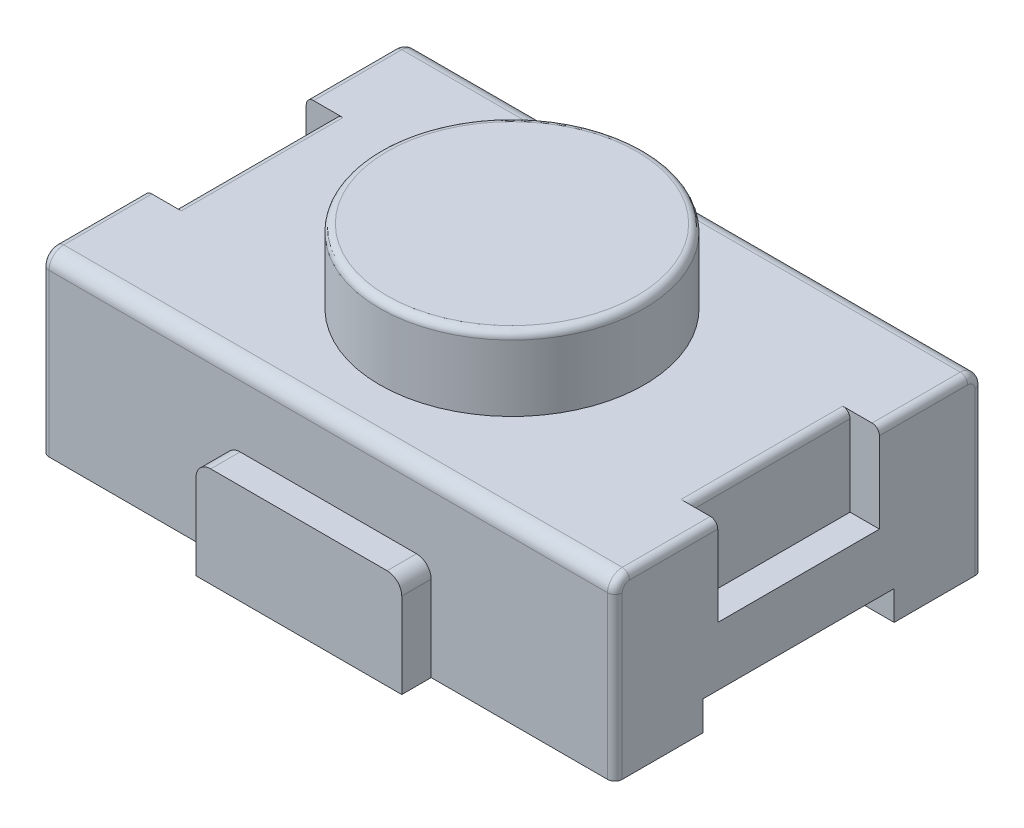
from build123d import *

# Parameters (mm, degrees)
SKETCH_1_W          = 3.9
SKETCH_1_H          = 2.5
EXTRUDE_1_DEPTH     = 1.2
SKETCH_2_R          = 0.9
EXTRUDE_2_DEPTH     = 0.5
EXTRUDE_3_DEPTH     = 0.2
SKETCH_4_W          = 1.1
SKETCH_4_H          = 0.6
CUT_EXTRUDE_1_DEPTH = 0.2
FILLET_1_R          = 0.1
SKETCH_5_W          = 1
SKETCH_5_H          = 1.3
CUT_EXTRUDE_2_DEPTH = 0.2
CUT_EXTRUDE_3_DEPTH = 0.01
FILLET_2_R          = 0.05
FILLET_4_R          = 0.05
FILLET_5_R          = 0.05


with BuildPart() as part:
    # 草图1 → 凸台-拉伸1 (new body)
    with BuildSketch(Plane(origin=(0, 0, 0), x_dir=(1, 0, 0), z_dir=(0, 1, 0))):
        Rectangle(SKETCH_1_W, SKETCH_1_H)
    extrude(amount=-EXTRUDE_1_DEPTH)

    # 草图2 → 凸台-拉伸2 (add)
    with BuildSketch(Plane(origin=(0, 0, 0), x_dir=(1, 0, 0), z_dir=(0, 1, 0))):
        Circle(SKETCH_2_R)
    extrude(amount=EXTRUDE_2_DEPTH)

    # 草图3 → 凸台-拉伸3 (add)
    with BuildSketch(Plane.XY.offset(1.25)):
        with BuildLine():
            Line((-0.6, -0.52), (0.6, -0.52))
            ThreePointArc((0.6, -0.52), (0.670710678, -0.549289322), (0.7, -0.62))
            Line((0.7, -0.62), (0.7, -1.2))
            Line((0.7, -1.2), (-0.7, -1.2))
            Line((-0.7, -1.2), (-0.7, -0.62))
            ThreePointArc((-0.7, -0.62), (-0.670710678, -0.549289322), (-0.6, -0.52))
        make_face()
    extrude_3 = extrude(amount=EXTRUDE_3_DEPTH)

    # 镜向1: 凸台-拉伸3 across plane
    add(extrude_3.mirror(Plane.XY))

    # 草图4 → 切除-拉伸1 (cut)
    with BuildSketch(Plane(origin=(1.95, 0, 0), x_dir=(0, 0, -1), z_dir=(1, 0, 0))):
        with Locations((0, -0.3)):
            Rectangle(SKETCH_4_W, SKETCH_4_H)
    cut_extrude_1 = extrude(amount=-CUT_EXTRUDE_1_DEPTH, mode=Mode.SUBTRACT)

    # 镜向2: 切除-拉伸1 across plane
    add(cut_extrude_1.mirror(Plane(origin=(0, 0, 0), x_dir=(0, 0, 1), z_dir=(1, 0, 0))), mode=Mode.SUBTRACT)

    # 圆角1
    fillet_1_edges = [part.edges().sort_by_distance(p)[0] for p in [
        (0, 0, 1.25),
        (0, 0, -1.25),
    ]]
    fillet(fillet_1_edges, radius=FILLET_1_R)

    # 草图5 → 切除-拉伸2 (cut)
    with BuildSketch(Plane.XZ.offset(1.2)):
        with Locations((-1.95, 0)):
            Rectangle(SKETCH_5_W, SKETCH_5_H)
    cut_extrude_2 = extrude(amount=-CUT_EXTRUDE_2_DEPTH, mode=Mode.SUBTRACT)

    # 镜向3: 切除-拉伸2 across plane
    add(cut_extrude_2.mirror(Plane(origin=(0, 0, 0), x_dir=(0, 0, 1), z_dir=(1, 0, 0))), mode=Mode.SUBTRACT)

    # 草图6 → 切除-拉伸3 (cut)
    # profile 1 of 18: a face of its own
    with BuildSketch(Plane(origin=(0, -1.2, 0), x_dir=(-1, 0, 0), z_dir=(0, -1, 0))):
        with BuildLine():
            add(Edge.make_bspline(
                [(1.228237473, -0.051109601), (1.228285145, -0.048759436), (1.22837866, -0.044149232), (1.229108055, -0.038476476), (1.229940158, -0.034118306), (1.23075727, -0.030996224), (1.231742981, -0.027991265), (1.232852371, -0.025084271), (1.234213558, -0.022325172), (1.23568393, -0.019658807), (1.23741111, -0.017171236), (1.239262914, -0.014777405), (1.241320413, -0.012514487), (1.243648641, -0.010474426), (1.246146331, -0.008541924), (1.248898541, -0.006826181), (1.251877031, -0.005299359), (1.255051739, -0.003888235), (1.258492682, -0.002765011), (1.26214375, -0.001751474), (1.266047804, -0.000963532), (1.27020784, -0.00040421), (1.274623585, -6.0852e-05), (1.277655615, -2.0634e-05), (1.279211205, 0)],
                knots=[0, 0, 0, 0, 1.874770978, 3.677645334, 4.555394571, 5.414487718, 6.250744093, 7.078518084, 7.894837726, 8.704014156, 9.50598375, 10.308496101, 11.118501685, 11.941902574, 12.775616767, 13.636334489, 14.525420061, 15.445315287, 16.405376085, 17.410760046, 18.468073069, 19.580652696, 20.758748205, 22, 22, 22, 22], degree=3))
            Line((1.279211205, 0), (1.300701241, 0))
            Line((1.300701241, 0), (1.300701241, -0.1))
            Line((1.300701241, -0.1), (1.274840734, -0.1))
            add(Edge.make_bspline(
                [(1.274840734, -0.1), (1.272944688, -0.099968837), (1.269264348, -0.099908347), (1.263931178, -0.099339552), (1.258970386, -0.098390193), (1.25437188, -0.097095544), (1.250155472, -0.09538391), (1.24629526, -0.093329597), (1.242820707, -0.090860052), (1.239717268, -0.088007205), (1.236977188, -0.084771449), (1.234637517, -0.081121475), (1.232629585, -0.077096074), (1.23104517, -0.072647551), (1.229769401, -0.067823859), (1.228884371, -0.062602119), (1.228331858, -0.056986573), (1.22826962, -0.053111268), (1.228237473, -0.051109601)],
                knots=[0, 0, 0, 0, 1.171804566, 2.274543161, 3.31047596, 4.291127812, 5.222611275, 6.118249426, 6.988312707, 7.850242438, 8.71774943, 9.601740169, 10.524097841, 11.492438693, 12.515597897, 13.604927327, 14.762900395, 16, 16, 16, 16], degree=3))
        make_face()
        with BuildLine():
            add(Edge.make_bspline(
                [(1.242730226, -0.04995471), (1.242744776, -0.051661654), (1.242772757, -0.054944442), (1.243183287, -0.059651436), (1.243737252, -0.063963751), (1.244598316, -0.067872434), (1.245701781, -0.071408506), (1.247055483, -0.074581009), (1.248673334, -0.077394569), (1.250536162, -0.079877647), (1.252690513, -0.081989424), (1.25506842, -0.083813193), (1.257725112, -0.085280095), (1.260627101, -0.086470279), (1.263795716, -0.087331158), (1.267209877, -0.087972151), (1.270885792, -0.088320235), (1.273420983, -0.088376698), (1.274727509, -0.088405797)],
                knots=[0, 0, 0, 0, 1.413317699, 2.71808822, 3.910861475, 5.012152221, 6.028496422, 6.975042758, 7.862971364, 8.710769282, 9.537488278, 10.35402632, 11.185366001, 12.043361187, 12.945960075, 13.899972198, 14.917738425, 16, 16, 16, 16], degree=3))
            Line((1.274727509, -0.088405797), (1.286208487, -0.088405797))
            Line((1.286208487, -0.088405797), (1.286208487, -0.011594203))
            Line((1.286208487, -0.011594203), (1.276222074, -0.011594203))
            add(Edge.make_bspline(
                [(1.276222074, -0.011594203), (1.274870068, -0.011628059), (1.272242026, -0.011693868), (1.268423157, -0.01210368), (1.264880135, -0.012886626), (1.261590405, -0.013922766), (1.258553903, -0.015252298), (1.255794624, -0.016925902), (1.253284068, -0.018877719), (1.251042796, -0.021148717), (1.249065973, -0.023719681), (1.24736688, -0.026601463), (1.245912374, -0.029763363), (1.244738547, -0.033225355), (1.243842235, -0.036987343), (1.243189734, -0.041043799), (1.242808694, -0.045403343), (1.242756917, -0.048406546), (1.242730226, -0.04995471)],
                knots=[0, 0, 0, 0, 1.112368836, 2.162232858, 3.153671654, 4.092370021, 4.995862172, 5.873374016, 6.740409183, 7.605418486, 8.490978658, 9.401506614, 10.351738463, 11.349303293, 12.403565438, 13.529577563, 14.726485918, 16, 16, 16, 16], degree=3))
        make_face(mode=Mode.SUBTRACT)
    # profile 2 of 18: a face of its own
    with BuildSketch(Plane(origin=(0, -1.2, 0), x_dir=(-1, 0, 0), z_dir=(0, -1, 0))):
        with BuildLine():
            add(Edge.make_bspline(
                [(1.147078052, -0.043002717), (1.147085213, -0.042149824), (1.147098268, -0.040594858), (1.147121855, -0.038426471), (1.147259109, -0.036541273), (1.147335468, -0.035356302), (1.147372436, -0.034782609)],
                knots=[0, 0, 0, 0, 1.244047524, 2.268106279, 3.161519522, 4, 4, 4, 4], degree=3))
            Line((1.147372436, -0.034782609), (1.200701241, -0.034782609))
            add(Edge.make_bspline(
                [(1.200701241, -0.034782609), (1.200689036, -0.033822917), (1.200665227, -0.031950733), (1.200330506, -0.029234072), (1.199841807, -0.026678851), (1.199150667, -0.024288321), (1.19821118, -0.022087362), (1.197096991, -0.020048292), (1.195781797, -0.018180306), (1.194252787, -0.016501655), (1.192551486, -0.014994391), (1.190650021, -0.013701022), (1.18858167, -0.012585503), (1.186328616, -0.011673206), (1.183884685, -0.011006898), (1.181272272, -0.010514727), (1.178480029, -0.010180477), (1.176555218, -0.010157001), (1.175565371, -0.010144928)],
                knots=[0, 0, 0, 0, 1.14700002, 2.237589561, 3.267936004, 4.256219488, 5.206846551, 6.123966898, 7.030632079, 7.931752958, 8.833596976, 9.74250627, 10.675482733, 11.639346986, 12.642484095, 13.699416684, 14.81690925, 16, 16, 16, 16], degree=3))
            add(Edge.make_bspline(
                [(1.175565371, -0.010144928), (1.174463043, -0.010159195), (1.172256967, -0.010187748), (1.168965057, -0.01038085), (1.165724835, -0.010643926), (1.16258429, -0.011008337), (1.159565975, -0.011444196), (1.156695654, -0.011911333), (1.153987535, -0.012420339), (1.152262164, -0.012840047), (1.151425879, -0.013043478)],
                knots=[0, 0, 0, 0, 1.085796583, 2.172992471, 3.247400383, 4.287744513, 5.286691758, 6.251145688, 7.152332544, 8, 8, 8, 8], degree=3))
            Line((1.151425879, -0.013043478), (1.151425879, -0.001449275))
            add(Edge.make_bspline(
                [(1.151425879, -0.001449275), (1.152353245, -0.001240501), (1.154269971, -0.000808995), (1.157235833, -0.000243928), (1.160388739, 0.000221915), (1.16484948, 0.000804023), (1.170669519, 0.001338888), (1.175390384, 0.00141213), (1.177784574, 0.001449275)],
                knots=[0, 0, 0, 0, 0.64391659, 1.330877428, 2.044643027, 2.802557912, 4.37841532, 6, 6, 6, 6], degree=3))
            add(Edge.make_bspline(
                [(1.177784574, 0.001449275), (1.179363861, 0.001425199), (1.182426027, 0.001378515), (1.186840956, 0.000840161), (1.190925311, 2.235e-05), (1.194661557, -0.001154806), (1.198064651, -0.002664083), (1.201161149, -0.004445218), (1.203937431, -0.006547012), (1.206372505, -0.008973887), (1.208513228, -0.011677808), (1.210336089, -0.014688885), (1.211879349, -0.017972504), (1.213084601, -0.021550413), (1.214040248, -0.025374665), (1.214704198, -0.029449789), (1.215121825, -0.03376996), (1.215169522, -0.036729074), (1.215193994, -0.038247283)],
                knots=[0, 0, 0, 0, 1.211361278, 2.34877554, 3.407595662, 4.404216134, 5.348219309, 6.259301301, 7.139816658, 8.012292358, 8.890747402, 9.779909225, 10.707634027, 11.669385691, 12.672516801, 13.729592442, 14.835140859, 16, 16, 16, 16], degree=3))
            add(Edge.make_bspline(
                [(1.215193994, -0.038247283), (1.215172982, -0.039584854), (1.215131426, -0.042230219), (1.214645598, -0.046140668), (1.213942435, -0.049946518), (1.212911772, -0.053615369), (1.211644546, -0.057130408), (1.210036769, -0.060420974), (1.208210656, -0.06352003), (1.206095865, -0.0663756), (1.203744817, -0.068994017), (1.201114007, -0.071322457), (1.198228959, -0.073365059), (1.19509786, -0.075111399), (1.191735405, -0.076536858), (1.188124519, -0.077517599), (1.184305993, -0.078151903), (1.181682106, -0.078224058), (1.180343451, -0.07826087)],
                knots=[0, 0, 0, 0, 1.079564461, 2.135094794, 3.177589889, 4.202489095, 5.20918975, 6.190678478, 7.155596615, 8.110216423, 9.055369598, 9.992389046, 10.941230561, 11.904529966, 12.882662453, 13.882436994, 14.91966138, 16, 16, 16, 16], degree=3))
            add(Edge.make_bspline(
                [(1.180343451, -0.07826087), (1.17904354, -0.078232324), (1.176502583, -0.078176527), (1.172812309, -0.077687539), (1.169341727, -0.076929931), (1.16611372, -0.075843621), (1.163133818, -0.074447302), (1.160380402, -0.072819074), (1.157863776, -0.070930417), (1.155617416, -0.068762006), (1.1535999, -0.066352111), (1.151896546, -0.063663034), (1.150400615, -0.06075917), (1.149186541, -0.057607446), (1.148242511, -0.054231653), (1.147566423, -0.050656034), (1.147152194, -0.046892335), (1.147103108, -0.044317202), (1.147078052, -0.043002717)],
                knots=[0, 0, 0, 0, 1.134338906, 2.217311109, 3.243672757, 4.231400438, 5.183628691, 6.111444174, 7.019486442, 7.92362303, 8.831450086, 9.756335926, 10.696448589, 11.679085594, 12.699187911, 13.752463383, 14.85273878, 16, 16, 16, 16], degree=3))
        make_face()
        with BuildLine():
            add(Edge.make_bspline(
                [(1.161570806, -0.044927536), (1.161549038, -0.045765646), (1.161506633, -0.04739829), (1.161682999, -0.049804118), (1.161981705, -0.052101555), (1.162483924, -0.054292295), (1.16315901, -0.056346606), (1.163995701, -0.058260982), (1.165002096, -0.060019128), (1.166156382, -0.061633701), (1.167471427, -0.063092986), (1.168960952, -0.064370363), (1.170599491, -0.06547602), (1.172370807, -0.066444674), (1.174313721, -0.067188364), (1.176401053, -0.067732658), (1.178642985, -0.068049849), (1.180183924, -0.068093475), (1.180977509, -0.068115942)],
                knots=[0, 0, 0, 0, 1.168765619, 2.276763896, 3.360790045, 4.397775566, 5.406637694, 6.373070759, 7.306832744, 8.227261847, 9.136664546, 10.040012852, 10.957002891, 11.889755179, 12.849800721, 13.850885921, 14.893203022, 16, 16, 16, 16], degree=3))
            add(Edge.make_bspline(
                [(1.180977509, -0.068115942), (1.181665585, -0.068092844), (1.183026408, -0.068047162), (1.185017017, -0.06772572), (1.18691565, -0.067201943), (1.188712374, -0.066478546), (1.190395019, -0.065542074), (1.191958124, -0.064423499), (1.193423343, -0.063156767), (1.194733789, -0.061689879), (1.1959383, -0.060075589), (1.197024067, -0.058310682), (1.197976262, -0.056389689), (1.198814221, -0.054332585), (1.199509627, -0.052134903), (1.200076002, -0.049829063), (1.20049148, -0.047415135), (1.200630469, -0.045766834), (1.200701241, -0.044927536)],
                knots=[0, 0, 0, 0, 0.978329625, 1.934861602, 2.859416398, 3.774386811, 4.682530879, 5.590992113, 6.503882114, 7.431050586, 8.382145961, 9.365292948, 10.373439186, 11.427954517, 12.521101649, 13.648447861, 14.802613548, 16, 16, 16, 16], degree=3))
            Line((1.200701241, -0.044927536), (1.161570806, -0.044927536))
        make_face(mode=Mode.SUBTRACT)
    # profile 3 of 18: a face of its own
    with BuildSketch(Plane(origin=(0, -1.2, 0), x_dir=(-1, 0, 0), z_dir=(0, -1, 0))):
        with BuildLine():
            add(Edge.make_bspline(
                [(1.064469357, -0.020923913), (1.064488154, -0.020266461), (1.064525021, -0.018976968), (1.064772548, -0.017094149), (1.065198155, -0.015314465), (1.066024372, -0.013119142), (1.067387849, -0.01057003), (1.069550439, -0.007869216), (1.072160892, -0.00555115), (1.075147134, -0.00361142), (1.078418784, -0.00202436), (1.081881154, -0.000707827), (1.085500168, 0.000283894), (1.089208794, 0.00094368), (1.092916663, 0.001367361), (1.095386142, 0.001422243), (1.096602509, 0.001449275)],
                knots=[0, 0, 0, 0, 0.633224649, 1.241974725, 1.825677126, 2.391583589, 3.49760032, 4.594498076, 5.706711027, 6.84608862, 8.013425496, 9.203101052, 10.409609719, 11.621801041, 12.828594476, 14, 14, 14, 14], degree=3))
            add(Edge.make_bspline(
                [(1.096602509, 0.001449275), (1.09788586, 0.00143411), (1.10039347, 0.001404477), (1.104081649, 0.001234785), (1.107600517, 0.000886634), (1.112089527, 0.000286139), (1.117565612, -0.000793076), (1.121781209, -0.002196584), (1.123889647, -0.002898551)],
                knots=[0, 0, 0, 0, 0.831811877, 1.625322051, 2.392032895, 3.122667034, 4.560896814, 6, 6, 6, 6], degree=3))
            Line((1.123889647, -0.002898551), (1.123889647, -0.014492754))
            add(Edge.make_bspline(
                [(1.123889647, -0.014492754), (1.121687128, -0.013830369), (1.117321499, -0.012517453), (1.110681605, -0.011196258), (1.104092475, -0.010295713), (1.099707802, -0.010194952), (1.097530951, -0.010144928)],
                knots=[0, 0, 0, 0, 1.02863214, 2.03885914, 3.026355579, 4, 4, 4, 4], degree=3))
            add(Edge.make_bspline(
                [(1.097530951, -0.010144928), (1.096768486, -0.010155456), (1.095287998, -0.010175901), (1.093141264, -0.010280528), (1.091154961, -0.010487541), (1.089315888, -0.010753524), (1.087638027, -0.011113596), (1.086103077, -0.011533986), (1.084737281, -0.012064466), (1.083162777, -0.012806681), (1.08150747, -0.013943365), (1.0800225, -0.015648359), (1.079125306, -0.017675693), (1.079017483, -0.0191186), (1.07896211, -0.019859601)],
                knots=[0, 0, 0, 0, 1.176888106, 2.285176942, 3.315731153, 4.258163783, 5.151580879, 5.962914622, 6.711516842, 7.409744155, 8.647615871, 9.779832816, 10.859839252, 12, 12, 12, 12], degree=3))
            add(Edge.make_bspline(
                [(1.07896211, -0.019859601), (1.078998544, -0.020511182), (1.079069281, -0.021776239), (1.079582125, -0.023634249), (1.080690624, -0.025303092), (1.08198302, -0.026573466), (1.083367011, -0.02752952), (1.084707363, -0.028286373), (1.086291044, -0.029080726), (1.088157508, -0.029871859), (1.090321922, -0.030718333), (1.092837811, -0.03158368), (1.09569881, -0.032551137), (1.097740266, -0.033166084), (1.098821712, -0.033491848)],
                knots=[0, 0, 0, 0, 0.907033895, 1.761025033, 2.643781523, 3.661133518, 4.264219769, 4.979329439, 5.801207049, 6.727847601, 7.798492517, 9.034023171, 10.428795725, 12, 12, 12, 12], degree=3))
            add(Edge.make_bspline(
                [(1.098821712, -0.033491848), (1.100459579, -0.034021599), (1.103643582, -0.035051431), (1.107459556, -0.036616164), (1.110289872, -0.037988397), (1.112248074, -0.039087376), (1.114029862, -0.040326492), (1.115703027, -0.041606726), (1.1171948, -0.04301204), (1.118529813, -0.044522362), (1.119685346, -0.046153755), (1.12066651, -0.04791361), (1.12147498, -0.04980417), (1.122036601, -0.051868052), (1.122379073, -0.054087227), (1.122419608, -0.055622219), (1.122440371, -0.056408514)],
                knots=[0, 0, 0, 0, 2.02729134, 3.941039803, 4.851674479, 5.731757607, 6.582609066, 7.406121502, 8.21128498, 8.992527354, 9.777051743, 10.561223345, 11.362153495, 12.192692167, 13.074211433, 14, 14, 14, 14], degree=3))
            add(Edge.make_bspline(
                [(1.122440371, -0.056408514), (1.122423943, -0.056960857), (1.12239019, -0.058095721), (1.12206753, -0.059829609), (1.121591898, -0.061638684), (1.120944034, -0.063512288), (1.120073354, -0.065399285), (1.118889969, -0.067212859), (1.117491, -0.068997564), (1.115778015, -0.070667373), (1.113786492, -0.072242844), (1.111489167, -0.073705105), (1.108841102, -0.074963222), (1.105914355, -0.076175706), (1.102605239, -0.077119824), (1.098919428, -0.077783767), (1.09485289, -0.078191763), (1.092014151, -0.078237182), (1.090533668, -0.07826087)],
                knots=[0, 0, 0, 0, 0.614663158, 1.26290828, 1.958289766, 2.697474646, 3.468486981, 4.266130258, 5.103841247, 5.989658999, 6.923224655, 7.928501749, 9.015143952, 10.184502501, 11.453690516, 12.838851504, 14.351371531, 16, 16, 16, 16], degree=3))
            add(Edge.make_bspline(
                [(1.090533668, -0.07826087), (1.08892505, -0.078225446), (1.085535555, -0.078150807), (1.080252278, -0.077671347), (1.074602287, -0.076780048), (1.070781312, -0.075843659), (1.068817183, -0.075362319)],
                knots=[0, 0, 0, 0, 0.878789406, 1.851684061, 2.89568244, 4, 4, 4, 4], degree=3))
            Line((1.068817183, -0.075362319), (1.068817183, -0.063768116))
            add(Edge.make_bspline(
                [(1.068817183, -0.063768116), (1.070835451, -0.064222395), (1.074740488, -0.065101355), (1.079592558, -0.065848163), (1.083244414, -0.066296057), (1.085754061, -0.066483669), (1.088078565, -0.066639617), (1.089567243, -0.066657871), (1.090284574, -0.066666667)],
                knots=[0, 0, 0, 0, 1.715110988, 3.318474709, 4.068510855, 4.76561266, 5.405201082, 6, 6, 6, 6], degree=3))
            add(Edge.make_bspline(
                [(1.090284574, -0.066666667), (1.091069788, -0.066658561), (1.092581095, -0.066642961), (1.094750434, -0.066508854), (1.096730952, -0.066284466), (1.098526891, -0.065978479), (1.100136745, -0.065553502), (1.101597502, -0.065128124), (1.10287116, -0.064561874), (1.104346756, -0.06382309), (1.105836182, -0.062683185), (1.107113156, -0.061031036), (1.107814562, -0.059186552), (1.10790325, -0.057908422), (1.107947618, -0.057269022)],
                knots=[0, 0, 0, 0, 1.268911461, 2.442282869, 3.510567692, 4.489289903, 5.382806353, 6.200764045, 6.943991378, 7.631468004, 8.866142492, 9.937209673, 10.968063781, 12, 12, 12, 12], degree=3))
            add(Edge.make_bspline(
                [(1.107947618, -0.057269022), (1.107909401, -0.056607694), (1.10783526, -0.055324696), (1.107211275, -0.053450169), (1.106040044, -0.051689596), (1.104534759, -0.050435884), (1.103039559, -0.049434141), (1.101657329, -0.048641047), (1.100051258, -0.047877718), (1.098238073, -0.047086378), (1.096179878, -0.046261245), (1.093844159, -0.045428548), (1.091212441, -0.044573349), (1.089357002, -0.04400385), (1.0883824, -0.04370471)],
                knots=[0, 0, 0, 0, 0.932422018, 1.808928537, 2.755083399, 3.880320102, 4.548545252, 5.298282105, 6.127893552, 7.058790757, 8.092154708, 9.258894358, 10.560186888, 12, 12, 12, 12], degree=3))
            add(Edge.make_bspline(
                [(1.0883824, -0.04370471), (1.08731687, -0.043369036), (1.085260958, -0.042721363), (1.082310304, -0.041721076), (1.079646275, -0.040645142), (1.077212415, -0.039591266), (1.075039147, -0.038454097), (1.073073049, -0.037277112), (1.071321547, -0.03603006), (1.069774704, -0.03472089), (1.068430535, -0.033327324), (1.067338989, -0.031823387), (1.066375178, -0.030272946), (1.065662219, -0.028603807), (1.065104064, -0.026845113), (1.06476806, -0.024963665), (1.064491899, -0.02298508), (1.064476964, -0.021619442), (1.064469357, -0.020923913)],
                knots=[0, 0, 0, 0, 1.48778496, 2.870639711, 4.147420059, 5.312991843, 6.401040466, 7.411268251, 8.362458014, 9.260874371, 10.106987725, 10.933283595, 11.731464194, 12.53267731, 13.343418565, 14.183238798, 15.07471137, 16, 16, 16, 16], degree=3))
        make_face()
    # profile 4 of 18: a face of its own
    with BuildSketch(Plane(origin=(0, -1.2, 0), x_dir=(-1, 0, 0), z_dir=(0, -1, 0))):
        Polygon((1.015193994, -0.065217391), (1.036933125, -0.065217391), (1.036933125, -0.076811594), (1.000701241, -0.076811594), (1.000701241, -0.011594203), (0.97896211, -0.011594203), (0.97896211, 0), (1.039831676, 0), (1.039831676, -0.011594203), (1.015193994, -0.011594203), align=None)
    # profile 5 of 18: a face of its own
    with BuildSketch(Plane(origin=(0, -1.2, 0), x_dir=(-1, 0, 0), z_dir=(0, -1, 0))):
        with BuildLine():
            add(Edge.make_bspline(
                [(1.010121531, -0.108695652), (1.009378849, -0.108653058), (1.007916699, -0.108569201), (1.005816403, -0.108012434), (1.003965419, -0.107025899), (1.002332975, -0.105795634), (1.001048545, -0.104246387), (1.000023789, -0.102534767), (0.999356364, -0.100605329), (0.999287137, -0.09924291), (0.999251965, -0.098550725)],
                knots=[0, 0, 0, 0, 1.07892263, 2.124120561, 3.124425955, 4.109048099, 5.073442882, 6.026744014, 6.997474169, 8, 8, 8, 8], degree=3))
            add(Edge.make_bspline(
                [(0.999251965, -0.098550725), (0.999287893, -0.097873443), (0.999359383, -0.096525769), (1.0000361, -0.094604205), (1.001033279, -0.092860803), (1.002335794, -0.091309058), (1.003958254, -0.090068887), (1.005827147, -0.089123828), (1.007911699, -0.08852326), (1.009377844, -0.088445327), (1.010121531, -0.088405797)],
                knots=[0, 0, 0, 0, 0.98131074, 1.952637402, 2.925511502, 3.890498899, 4.875726085, 5.87164409, 6.92041438, 8, 8, 8, 8], degree=3))
            add(Edge.make_bspline(
                [(1.010121531, -0.088405797), (1.010865741, -0.088443972), (1.012325645, -0.08851886), (1.014402626, -0.089136026), (1.016280437, -0.090053135), (1.017884128, -0.091325548), (1.019212753, -0.092851375), (1.020205519, -0.094605575), (1.020884043, -0.096525423), (1.02095529, -0.097873327), (1.020991096, -0.098550725)],
                knots=[0, 0, 0, 0, 1.079890346, 2.118401423, 3.124403101, 4.101256702, 5.073662736, 6.046811442, 7.018412273, 8, 8, 8, 8], degree=3))
            add(Edge.make_bspline(
                [(1.020991096, -0.098550725), (1.020956051, -0.09924303), (1.020887073, -0.100605685), (1.020217836, -0.102533406), (1.019197307, -0.104255665), (1.017886916, -0.105779132), (1.016273401, -0.107041739), (1.014413328, -0.10800028), (1.012320606, -0.108573563), (1.010864728, -0.108654391), (1.010121531, -0.108695652)],
                knots=[0, 0, 0, 0, 1.002818452, 1.973831949, 2.927411335, 3.899229547, 4.875492638, 5.885838159, 6.92076245, 8, 8, 8, 8], degree=3))
        make_face()
    # profile 6 of 18: a face of its own
    with BuildSketch(Plane(origin=(0, -1.2, 0), x_dir=(-1, 0, 0), z_dir=(0, -1, 0))):
        with BuildLine():
            add(Edge.make_bspline(
                [(0.899478415, -0.066666667), (0.898799013, -0.065653589), (0.897401258, -0.063569352), (0.896237092, -0.06058686), (0.895557824, -0.058032877), (0.895169083, -0.056013434), (0.894936482, -0.05391556), (0.894915053, -0.052491545), (0.894904139, -0.051766304)],
                knots=[0, 0, 0, 0, 1.382106212, 2.843450905, 3.606591397, 4.383332773, 5.176643252, 6, 6, 6, 6], degree=3))
            add(Edge.make_bspline(
                [(0.894904139, -0.051766304), (0.894929843, -0.050776193), (0.8949803, -0.048832575), (0.895389451, -0.045982405), (0.896102779, -0.043278912), (0.897050444, -0.040699859), (0.898269033, -0.038285141), (0.89973889, -0.036046635), (0.901408591, -0.033975304), (0.903330475, -0.032115294), (0.9054479, -0.030434454), (0.907757878, -0.028927041), (0.910293204, -0.02767176), (0.912992975, -0.026581524), (0.91586514, -0.025684001), (0.918904956, -0.025101686), (0.9220741, -0.024684854), (0.924235415, -0.024653626), (0.925338922, -0.024637681)],
                knots=[0, 0, 0, 0, 1.038105152, 2.037832863, 3.01129624, 3.965613191, 4.914398204, 5.84096191, 6.769451138, 7.698716201, 8.639542024, 9.601283132, 10.585470087, 11.601241225, 12.652930284, 13.73501572, 14.84356192, 16, 16, 16, 16], degree=3))
            add(Edge.make_bspline(
                [(0.925338922, -0.024637681), (0.926912938, -0.02467709), (0.929984082, -0.024753981), (0.933703409, -0.025460901), (0.936435243, -0.026184982), (0.938250795, -0.026768398), (0.939830217, -0.027432481), (0.940771884, -0.02796576), (0.941213016, -0.02821558)],
                knots=[0, 0, 0, 0, 1.721416669, 3.35874597, 4.128542546, 4.815888042, 5.445293058, 6, 6, 6, 6], degree=3))
            add(Edge.make_bspline(
                [(0.941213016, -0.02821558), (0.941602117, -0.02753065), (0.942338187, -0.026234955), (0.943341308, -0.02432516), (0.944090128, -0.022367403), (0.944149322, -0.020991413), (0.944179502, -0.020289855)],
                knots=[0, 0, 0, 0, 1.102008439, 2.084692499, 3.023467744, 4, 4, 4, 4], degree=3))
            add(Edge.make_bspline(
                [(0.944179502, -0.020289855), (0.944144406, -0.019861287), (0.9440746, -0.019008864), (0.943508448, -0.01781089), (0.942612908, -0.016738545), (0.941367858, -0.015839354), (0.939879429, -0.015030256), (0.938113103, -0.014497256), (0.93614997, -0.014094766), (0.934761511, -0.014014135), (0.934034574, -0.01397192)],
                knots=[0, 0, 0, 0, 0.780738176, 1.55288981, 2.376374303, 3.312141201, 4.343207134, 5.460542756, 6.670450795, 8, 8, 8, 8], degree=3))
            Line((0.934034574, -0.01397192), (0.913903234, -0.013201993))
            add(Edge.make_bspline(
                [(0.913903234, -0.013201993), (0.912966591, -0.013159018), (0.911127163, -0.013074623), (0.908418596, -0.012781095), (0.905826015, -0.012327403), (0.903348009, -0.01174657), (0.901013241, -0.011003348), (0.898839968, -0.010099171), (0.896837341, -0.009056971), (0.895008178, -0.007878125), (0.893365094, -0.006535266), (0.891915198, -0.005031685), (0.890627799, -0.003395946), (0.889565004, -0.001588735), (0.888684748, 0.000354068), (0.888120218, 0.002474964), (0.887704007, 0.00471652), (0.887673409, 0.00627055), (0.887657763, 0.007065217)],
                knots=[0, 0, 0, 0, 1.209535581, 2.375349289, 3.512123776, 4.603435974, 5.65675971, 6.669596345, 7.636636526, 8.56586431, 9.472411354, 10.367746858, 11.256063351, 12.151292917, 13.066948599, 13.998011796, 14.976265825, 16, 16, 16, 16], degree=3))
            add(Edge.make_bspline(
                [(0.887657763, 0.007065217), (0.887681275, 0.007935271), (0.887728182, 0.009671069), (0.888186176, 0.012225437), (0.888854612, 0.014723093), (0.889839971, 0.017131083), (0.891099666, 0.019444658), (0.892684859, 0.021612605), (0.894558562, 0.023634689), (0.896715622, 0.025529045), (0.899216782, 0.027230424), (0.90201606, 0.028759304), (0.9051329, 0.030103657), (0.908557553, 0.031245699), (0.912302945, 0.032219173), (0.916392853, 0.032840005), (0.920800933, 0.03326568), (0.923850773, 0.033310258), (0.925429502, 0.033333333)],
                knots=[0, 0, 0, 0, 0.809539675, 1.615070871, 2.409824314, 3.21397394, 4.031985297, 4.857394179, 5.708129939, 6.594958513, 7.525088108, 8.519268054, 9.561427585, 10.681855594, 11.878779711, 13.160481649, 14.53014269, 16, 16, 16, 16], degree=3))
            add(Edge.make_bspline(
                [(0.925429502, 0.033333333), (0.926924587, 0.033319014), (0.929804692, 0.03329143), (0.93395557, 0.032996383), (0.937760194, 0.032508774), (0.941229488, 0.031822906), (0.94438186, 0.030998807), (0.947236444, 0.0299975), (0.949796026, 0.028856132), (0.952061588, 0.027553968), (0.954047646, 0.026133031), (0.955741741, 0.024561645), (0.957145992, 0.022851669), (0.958229533, 0.020997574), (0.959072743, 0.01905606), (0.959693263, 0.017022619), (0.960063156, 0.014883745), (0.960101887, 0.013422343), (0.960121531, 0.012681159)],
                knots=[0, 0, 0, 0, 1.585076654, 3.053463981, 4.409583427, 5.64963082, 6.80089958, 7.861547137, 8.853825241, 9.768152633, 10.627881961, 11.437691384, 12.211456886, 12.965048132, 13.707031464, 14.451428317, 15.214606924, 16, 16, 16, 16], degree=3))
            add(Edge.make_bspline(
                [(0.960121531, 0.012681159), (0.960093972, 0.01174265), (0.960040254, 0.009913326), (0.959537174, 0.007263454), (0.958797205, 0.004769207), (0.957632414, 0.002473708), (0.956225227, 0.000256806), (0.954408123, -0.001836311), (0.952344538, -0.003971369), (0.950739876, -0.005248683), (0.949908668, -0.005910326)],
                knots=[0, 0, 0, 0, 1.019386682, 1.986966716, 2.924129863, 3.838147809, 4.776137268, 5.772395593, 6.846111641, 8, 8, 8, 8], degree=3))
            add(Edge.make_bspline(
                [(0.949908668, -0.005910326), (0.950509663, -0.006230873), (0.951684972, -0.006857736), (0.953211044, -0.008105555), (0.954491108, -0.009508297), (0.95548965, -0.011074081), (0.956268499, -0.012734482), (0.95679415, -0.01447663), (0.957156305, -0.016236774), (0.95720097, -0.017419779), (0.95722298, -0.018002717)],
                knots=[0, 0, 0, 0, 1.0941393, 2.139705412, 3.154823763, 4.138927514, 5.1173895, 6.097359133, 7.062452279, 8, 8, 8, 8], degree=3))
            add(Edge.make_bspline(
                [(0.95722298, -0.018002717), (0.957200419, -0.018797619), (0.957156023, -0.020361859), (0.956697233, -0.022648324), (0.956012682, -0.02484415), (0.954626773, -0.02758971), (0.952555796, -0.03087805), (0.950570045, -0.033278245), (0.949568994, -0.034488225)],
                knots=[0, 0, 0, 0, 0.768360052, 1.51200977, 2.249026707, 2.987490621, 4.481342937, 6, 6, 6, 6], degree=3))
            add(Edge.make_bspline(
                [(0.949568994, -0.034488225), (0.950036646, -0.035071627), (0.950941888, -0.036200932), (0.952157753, -0.037955743), (0.95326648, -0.039735371), (0.95412582, -0.04167198), (0.954878688, -0.043728235), (0.955391399, -0.04597883), (0.955715858, -0.048473317), (0.955753652, -0.050225295), (0.955773705, -0.051154891)],
                knots=[0, 0, 0, 0, 0.984725593, 1.906153955, 2.811776569, 3.741804867, 4.691718377, 5.692779159, 6.77579241, 8, 8, 8, 8], degree=3))
            add(Edge.make_bspline(
                [(0.955773705, -0.051154891), (0.955747728, -0.052137454), (0.955696543, -0.054073518), (0.955287977, -0.056915937), (0.954576602, -0.059620391), (0.953622964, -0.06219278), (0.952434381, -0.064613783), (0.950982885, -0.066843839), (0.949356092, -0.068931554), (0.947467706, -0.070794861), (0.945395143, -0.072498884), (0.943091187, -0.07395487), (0.940609374, -0.075266816), (0.937919588, -0.076337921), (0.935065224, -0.077205345), (0.932053586, -0.077803556), (0.92889786, -0.078212426), (0.926736723, -0.078244496), (0.925633306, -0.07826087)],
                knots=[0, 0, 0, 0, 1.035690846, 2.040749585, 3.019403937, 3.978809764, 4.929095084, 5.856272062, 6.779752912, 7.713905465, 8.647345844, 9.603213308, 10.582126495, 11.603314212, 12.650680664, 13.722937735, 14.837395237, 16, 16, 16, 16], degree=3))
            add(Edge.make_bspline(
                [(0.925633306, -0.07826087), (0.924704147, -0.078236071), (0.922878947, -0.078187358), (0.920235381, -0.07789848), (0.917809435, -0.077427914), (0.916293854, -0.077009133), (0.915578958, -0.076811594)],
                knots=[0, 0, 0, 0, 1.094059638, 2.149124309, 3.126946191, 4, 4, 4, 4], degree=3))
            Line((0.915578958, -0.076811594), (0.887657763, -0.076811594))
            Line((0.887657763, -0.076811594), (0.887657763, -0.066666667))
            Line((0.887657763, -0.066666667), (0.899478415, -0.066666667))
        make_face()
        with BuildLine():
            add(Edge.make_bspline(
                [(0.945628777, 0.011843297), (0.945609383, 0.01231958), (0.94557155, 0.01324868), (0.945335092, 0.01459986), (0.944863101, 0.015835219), (0.944254515, 0.016975421), (0.943468625, 0.01802371), (0.942480162, 0.018940421), (0.941343157, 0.019794216), (0.939511715, 0.020772863), (0.936855055, 0.02179356), (0.933192631, 0.022598808), (0.929007536, 0.02312376), (0.926027641, 0.023166081), (0.92445577, 0.023188406)],
                knots=[0, 0, 0, 0, 0.638955971, 1.246431272, 1.829290976, 2.40445378, 2.9753256, 3.576698873, 4.206286429, 4.876772993, 6.354171105, 8.006533783, 9.893478466, 12, 12, 12, 12], degree=3))
            add(Edge.make_bspline(
                [(0.92445577, 0.023188406), (0.923451081, 0.02318138), (0.921521295, 0.023167884), (0.918755614, 0.022899614), (0.916227855, 0.02254324), (0.9139605, 0.021968168), (0.911924465, 0.021275617), (0.910082929, 0.020528934), (0.90846483, 0.019625986), (0.907025719, 0.018672514), (0.90582, 0.017579766), (0.90476524, 0.016460486), (0.903911106, 0.015239466), (0.903058064, 0.013533869), (0.9023352, 0.01128678), (0.902211747, 0.009433632), (0.902150516, 0.008514493)],
                knots=[0, 0, 0, 0, 1.40810597, 2.704661865, 3.893248349, 4.984280915, 5.978385679, 6.908202706, 7.765618259, 8.572965012, 9.322753162, 10.041881072, 10.72604073, 11.402956916, 12.711896461, 14, 14, 14, 14], degree=3))
            add(Edge.make_bspline(
                [(0.902150516, 0.008514493), (0.90218467, 0.007715197), (0.90225006, 0.006184905), (0.903006994, 0.004064415), (0.904216389, 0.002267009), (0.905959285, 0.000852272), (0.90816457, -0.000221989), (0.910845211, -0.001013228), (0.914001321, -0.001604709), (0.916285542, -0.001754403), (0.917503777, -0.001834239)],
                knots=[0, 0, 0, 0, 0.917105305, 1.755845362, 2.556540372, 3.383707916, 4.30918354, 5.365258263, 6.594823622, 8, 8, 8, 8], degree=3))
            Line((0.917503777, -0.001834239), (0.937318089, -0.002513587))
            add(Edge.make_bspline(
                [(0.937318089, -0.002513587), (0.938084919, -0.001924028), (0.939525093, -0.000816784), (0.941389188, 0.000969829), (0.942875873, 0.002745536), (0.943965555, 0.004561107), (0.94478509, 0.006359458), (0.945268979, 0.00818464), (0.945582614, 0.010005467), (0.945613386, 0.011230563), (0.945628777, 0.011843297)],
                knots=[0, 0, 0, 0, 1.34025301, 2.517111606, 3.573050425, 4.540483433, 5.444775789, 6.303020254, 7.151251953, 8, 8, 8, 8], degree=3))
        make_face(mode=Mode.SUBTRACT)
        with BuildLine():
            add(Edge.make_bspline(
                [(0.941280951, -0.051449275), (0.94127064, -0.050844531), (0.941250328, -0.049653244), (0.94100775, -0.047905204), (0.940661088, -0.046224085), (0.939961528, -0.044141385), (0.938828974, -0.04173154), (0.936882434, -0.039297877), (0.934526607, -0.037332255), (0.93225268, -0.03611892), (0.93027369, -0.035437168), (0.928699501, -0.035044497), (0.927044087, -0.034815888), (0.925913295, -0.034793819), (0.925338922, -0.034782609)],
                knots=[0, 0, 0, 0, 0.840382659, 1.655470826, 2.450229062, 3.223696201, 4.707251017, 6.127003192, 7.520788189, 8.948435248, 9.682128002, 10.428108778, 11.201575917, 12, 12, 12, 12], degree=3))
            add(Edge.make_bspline(
                [(0.925338922, -0.034782609), (0.924719169, -0.03480108), (0.923512242, -0.034837051), (0.921749139, -0.035086287), (0.920094867, -0.035517461), (0.918055887, -0.036293806), (0.915766531, -0.037641104), (0.913461213, -0.03975257), (0.911678088, -0.042303421), (0.910371585, -0.045156636), (0.909557809, -0.048250267), (0.909450668, -0.050380224), (0.909396893, -0.051449275)],
                knots=[0, 0, 0, 0, 0.720289458, 1.402714253, 2.064524129, 2.703250792, 3.934119481, 5.12629447, 6.309395471, 7.526364832, 8.758452405, 10, 10, 10, 10], degree=3))
            add(Edge.make_bspline(
                [(0.909396893, -0.051449275), (0.909407224, -0.052054009), (0.909427575, -0.053245273), (0.90966987, -0.054993475), (0.910017565, -0.056674002), (0.910713305, -0.058762662), (0.911880744, -0.061151112), (0.913791909, -0.06361812), (0.91617104, -0.065549951), (0.918429732, -0.066784459), (0.920404492, -0.067460863), (0.921978249, -0.067854199), (0.923633782, -0.068082624), (0.924764558, -0.068104719), (0.925338922, -0.068115942)],
                knots=[0, 0, 0, 0, 0.840595192, 1.655889495, 2.450848726, 3.224511476, 4.71307779, 6.126691581, 7.528911548, 8.947663505, 9.681541812, 10.427711246, 11.201373995, 12, 12, 12, 12], degree=3))
            add(Edge.make_bspline(
                [(0.925338922, -0.068115942), (0.925958616, -0.068096943), (0.927172901, -0.068059714), (0.928936918, -0.067816624), (0.930594317, -0.067382002), (0.932619095, -0.066571124), (0.934899608, -0.065220056), (0.937191833, -0.06311087), (0.939002747, -0.06060443), (0.940313578, -0.057751393), (0.941117124, -0.054655095), (0.941226328, -0.052518158), (0.941280951, -0.051449275)],
                knots=[0, 0, 0, 0, 0.720724233, 1.41225271, 2.065969969, 2.708269785, 3.944347493, 5.124837754, 6.306633002, 7.516367939, 8.757702994, 10, 10, 10, 10], degree=3))
        make_face(mode=Mode.SUBTRACT)
    # profile 7 of 18: a face of its own
    with BuildSketch(Plane(origin=(0, -1.2, 0), x_dir=(-1, 0, 0), z_dir=(0, -1, 0))):
        with BuildLine():
            Line((0.870266458, -0.076811594), (0.85735885, -0.076811594))
            Line((0.85735885, -0.076811594), (0.856770081, -0.064424819))
            add(Edge.make_bspline(
                [(0.856770081, -0.064424819), (0.85622346, -0.065070239), (0.855165864, -0.06631899), (0.853549627, -0.068079542), (0.851950371, -0.069653941), (0.849908369, -0.071497141), (0.847383445, -0.073438405), (0.844360018, -0.075373294), (0.841290872, -0.076759081), (0.838178696, -0.077668546), (0.834980138, -0.078176272), (0.83282108, -0.07823238), (0.831724792, -0.07826087)],
                knots=[0, 0, 0, 0, 0.854384535, 1.653051333, 2.413337963, 3.120693495, 4.430864092, 5.626325571, 6.738927856, 7.819906534, 8.893030119, 10, 10, 10, 10], degree=3))
            add(Edge.make_bspline(
                [(0.831724792, -0.07826087), (0.830772851, -0.078238339), (0.828923865, -0.078194577), (0.826239033, -0.077879404), (0.823734049, -0.07734016), (0.821407209, -0.076572012), (0.819267866, -0.075568925), (0.817296016, -0.074358671), (0.815504256, -0.072933455), (0.813900774, -0.071280791), (0.812483492, -0.069404083), (0.811271754, -0.067299964), (0.810245941, -0.06497318), (0.809388617, -0.062444612), (0.80872776, -0.059678004), (0.808305015, -0.056697646), (0.807985054, -0.053501685), (0.807960391, -0.051299211), (0.807947618, -0.050158514)],
                knots=[0, 0, 0, 0, 1.084679849, 2.106811182, 3.075268463, 4.000112009, 4.892877769, 5.761829911, 6.6309949, 7.494780126, 8.379051886, 9.30409542, 10.255207175, 11.272549622, 12.342843114, 13.491239825, 14.700672517, 16, 16, 16, 16], degree=3))
            Line((0.807947618, -0.050158514), (0.807947618, 0))
            Line((0.807947618, 0), (0.822440371, 0))
            Line((0.822440371, 0), (0.822440371, -0.049003623))
            add(Edge.make_bspline(
                [(0.822440371, -0.049003623), (0.822446457, -0.049728595), (0.822458265, -0.051135133), (0.82262286, -0.053168343), (0.822870129, -0.055058154), (0.823199317, -0.056810414), (0.823654845, -0.058413389), (0.824187127, -0.059877884), (0.824854335, -0.06117708), (0.825601576, -0.062340999), (0.826444367, -0.063375478), (0.827394921, -0.064262508), (0.828461933, -0.064996406), (0.829610013, -0.065602747), (0.830853989, -0.066090015), (0.832193701, -0.066421538), (0.833635426, -0.066631756), (0.834630116, -0.066654772), (0.835144176, -0.066666667)],
                knots=[0, 0, 0, 0, 1.402894737, 2.721794483, 3.945054088, 5.091195941, 6.168898684, 7.167543479, 8.101918629, 8.989427716, 9.840596219, 10.677985337, 11.496684694, 12.339789845, 13.186306088, 14.075737234, 15.005532085, 16, 16, 16, 16], degree=3))
            add(Edge.make_bspline(
                [(0.835144176, -0.066666667), (0.835917215, -0.066632191), (0.837452586, -0.066563717), (0.839756792, -0.065986936), (0.842067114, -0.064954847), (0.844463893, -0.06339006), (0.846952232, -0.061201786), (0.849121806, -0.058984168), (0.850975484, -0.056884215), (0.85251538, -0.05507827), (0.854128184, -0.053074845), (0.855210589, -0.051662965), (0.855773705, -0.050928442)],
                knots=[0, 0, 0, 0, 0.861519276, 1.711104658, 2.631051107, 3.672768245, 4.891140489, 6.320180753, 7.13134188, 8.015444636, 8.967546704, 10, 10, 10, 10], degree=3))
            Line((0.855773705, -0.050928442), (0.855773705, 0))
            Line((0.855773705, 0), (0.870266458, 0))
            Line((0.870266458, 0), (0.870266458, -0.076811594))
        make_face()
    # profile 8 of 18: a face of its own
    with BuildSketch(Plane(origin=(0, -1.2, 0), x_dir=(-1, 0, 0), z_dir=(0, -1, 0))):
        with BuildLine():
            add(Edge.make_bspline(
                [(0.719541821, -0.043002717), (0.719548981, -0.042149824), (0.719562036, -0.040594858), (0.719585623, -0.038426471), (0.719722877, -0.036541273), (0.719799236, -0.035356302), (0.719836205, -0.034782609)],
                knots=[0, 0, 0, 0, 1.244047524, 2.268106279, 3.161519522, 4, 4, 4, 4], degree=3))
            Line((0.719836205, -0.034782609), (0.773165009, -0.034782609))
            add(Edge.make_bspline(
                [(0.773165009, -0.034782609), (0.773152804, -0.033822917), (0.773128995, -0.031950733), (0.772794274, -0.029234072), (0.772305576, -0.026678851), (0.771614435, -0.024288321), (0.770674948, -0.022087362), (0.769560759, -0.020048292), (0.768245565, -0.018180306), (0.766716555, -0.016501655), (0.765015254, -0.014994391), (0.763113789, -0.013701022), (0.761045438, -0.012585503), (0.758792384, -0.011673206), (0.756348454, -0.011006898), (0.75373604, -0.010514727), (0.750943797, -0.010180477), (0.749018986, -0.010157001), (0.748029139, -0.010144928)],
                knots=[0, 0, 0, 0, 1.14700002, 2.237589561, 3.267936004, 4.256219488, 5.206846551, 6.123966898, 7.030632079, 7.931752958, 8.833596976, 9.74250627, 10.675482733, 11.639346986, 12.642484095, 13.699416684, 14.81690925, 16, 16, 16, 16], degree=3))
            add(Edge.make_bspline(
                [(0.748029139, -0.010144928), (0.746926812, -0.010159195), (0.744720735, -0.010187748), (0.741428825, -0.01038085), (0.738188603, -0.010643926), (0.735048058, -0.011008337), (0.732029743, -0.011444196), (0.729159422, -0.011911333), (0.726451303, -0.012420339), (0.724725932, -0.012840047), (0.723889647, -0.013043478)],
                knots=[0, 0, 0, 0, 1.085796583, 2.172992471, 3.247400383, 4.287744513, 5.286691758, 6.251145688, 7.152332544, 8, 8, 8, 8], degree=3))
            Line((0.723889647, -0.013043478), (0.723889647, -0.001449275))
            add(Edge.make_bspline(
                [(0.723889647, -0.001449275), (0.724817013, -0.001240501), (0.726733739, -0.000808995), (0.729699601, -0.000243928), (0.732852507, 0.000221915), (0.737313248, 0.000804023), (0.743133287, 0.001338888), (0.747854153, 0.00141213), (0.750248342, 0.001449275)],
                knots=[0, 0, 0, 0, 0.64391659, 1.330877428, 2.044643027, 2.802557912, 4.37841532, 6, 6, 6, 6], degree=3))
            add(Edge.make_bspline(
                [(0.750248342, 0.001449275), (0.751827629, 0.001425199), (0.754889795, 0.001378515), (0.759304724, 0.000840161), (0.763389079, 2.235e-05), (0.767125325, -0.001154806), (0.770528419, -0.002664083), (0.773624917, -0.004445218), (0.776401199, -0.006547012), (0.778836273, -0.008973887), (0.780976996, -0.011677808), (0.782799857, -0.014688885), (0.784343117, -0.017972504), (0.785548369, -0.021550413), (0.786504016, -0.025374665), (0.787167967, -0.029449789), (0.787585593, -0.03376996), (0.787633291, -0.036729074), (0.787657763, -0.038247283)],
                knots=[0, 0, 0, 0, 1.211361278, 2.34877554, 3.407595662, 4.404216134, 5.348219309, 6.259301301, 7.139816658, 8.012292358, 8.890747402, 9.779909225, 10.707634027, 11.669385691, 12.672516801, 13.729592442, 14.835140859, 16, 16, 16, 16], degree=3))
            add(Edge.make_bspline(
                [(0.787657763, -0.038247283), (0.78763675, -0.039584854), (0.787595194, -0.042230219), (0.787109366, -0.046140668), (0.786406203, -0.049946518), (0.78537554, -0.053615369), (0.784108314, -0.057130408), (0.782500537, -0.060420974), (0.780674424, -0.06352003), (0.778559633, -0.0663756), (0.776208585, -0.068994017), (0.773577775, -0.071322457), (0.770692728, -0.073365059), (0.767561628, -0.075111399), (0.764199173, -0.076536858), (0.760588287, -0.077517599), (0.756769761, -0.078151903), (0.754145874, -0.078224058), (0.752807219, -0.07826087)],
                knots=[0, 0, 0, 0, 1.079564461, 2.135094794, 3.177589889, 4.202489095, 5.20918975, 6.190678478, 7.155596615, 8.110216423, 9.055369598, 9.992389046, 10.941230561, 11.904529966, 12.882662453, 13.882436994, 14.91966138, 16, 16, 16, 16], degree=3))
            add(Edge.make_bspline(
                [(0.752807219, -0.07826087), (0.751507308, -0.078232324), (0.748966351, -0.078176527), (0.745276077, -0.077687539), (0.741805495, -0.076929931), (0.738577489, -0.075843621), (0.735597586, -0.074447302), (0.73284417, -0.072819074), (0.730327545, -0.070930417), (0.728081184, -0.068762006), (0.726063669, -0.066352111), (0.724360315, -0.063663034), (0.722864383, -0.06075917), (0.721650309, -0.057607446), (0.720706279, -0.054231653), (0.720030192, -0.050656034), (0.719615962, -0.046892335), (0.719566876, -0.044317202), (0.719541821, -0.043002717)],
                knots=[0, 0, 0, 0, 1.134338906, 2.217311109, 3.243672757, 4.231400438, 5.183628691, 6.111444174, 7.019486442, 7.92362303, 8.831450086, 9.756335926, 10.696448589, 11.679085594, 12.699187911, 13.752463383, 14.85273878, 16, 16, 16, 16], degree=3))
        make_face()
        with BuildLine():
            add(Edge.make_bspline(
                [(0.734034574, -0.044927536), (0.734012806, -0.045765646), (0.733970401, -0.04739829), (0.734146767, -0.049804118), (0.734445473, -0.052101555), (0.734947692, -0.054292295), (0.735622778, -0.056346606), (0.73645947, -0.058260982), (0.737465864, -0.060019128), (0.73862015, -0.061633701), (0.739935195, -0.063092986), (0.74142472, -0.064370363), (0.743063259, -0.06547602), (0.744834575, -0.066444674), (0.746777489, -0.067188364), (0.748864821, -0.067732658), (0.751106754, -0.068049849), (0.752647692, -0.068093475), (0.753441277, -0.068115942)],
                knots=[0, 0, 0, 0, 1.168765619, 2.276763896, 3.360790045, 4.397775566, 5.406637694, 6.373070759, 7.306832744, 8.227261847, 9.136664546, 10.040012852, 10.957002891, 11.889755179, 12.849800721, 13.850885921, 14.893203022, 16, 16, 16, 16], degree=3))
            add(Edge.make_bspline(
                [(0.753441277, -0.068115942), (0.754129354, -0.068092844), (0.755490176, -0.068047162), (0.757480785, -0.06772572), (0.759379418, -0.067201943), (0.761176142, -0.066478546), (0.762858787, -0.065542074), (0.764421892, -0.064423499), (0.765887111, -0.063156767), (0.767197557, -0.061689879), (0.768402068, -0.060075589), (0.769487835, -0.058310682), (0.77044003, -0.056389689), (0.77127799, -0.054332585), (0.771973395, -0.052134903), (0.772539771, -0.049829063), (0.772955248, -0.047415135), (0.773094237, -0.045766834), (0.773165009, -0.044927536)],
                knots=[0, 0, 0, 0, 0.978329625, 1.934861602, 2.859416398, 3.774386811, 4.682530879, 5.590992113, 6.503882114, 7.431050586, 8.382145961, 9.365292948, 10.373439186, 11.427954517, 12.521101649, 13.648447861, 14.802613548, 16, 16, 16, 16], degree=3))
            Line((0.773165009, -0.044927536), (0.734034574, -0.044927536))
        make_face(mode=Mode.SUBTRACT)
    # profile 9 of 18: a face of its own
    with BuildSketch(Plane(origin=(0, -1.2, 0), x_dir=(-1, 0, 0), z_dir=(0, -1, 0))):
        with BuildLine():
            add(Edge.make_bspline(
                [(0.702150516, -0.037024457), (0.702125804, -0.03861878), (0.702077526, -0.041733434), (0.701536069, -0.046260375), (0.700711636, -0.050529413), (0.699537737, -0.054518997), (0.698042437, -0.058216452), (0.696264642, -0.061624923), (0.694208932, -0.064742936), (0.691840839, -0.067536384), (0.68921488, -0.070018133), (0.686356024, -0.072220327), (0.683202077, -0.074038948), (0.679845319, -0.075597549), (0.67624989, -0.076789575), (0.67245215, -0.077655145), (0.668445246, -0.078149732), (0.665708611, -0.078223296), (0.664310842, -0.07826087)],
                knots=[0, 0, 0, 0, 1.207944799, 2.359828718, 3.45053115, 4.500585583, 5.506777039, 6.469062364, 7.410105228, 8.331726752, 9.238324286, 10.144669009, 11.060231857, 11.992150555, 12.945686718, 13.925636933, 14.940494584, 16, 16, 16, 16], degree=3))
            add(Edge.make_bspline(
                [(0.664310842, -0.07826087), (0.663087303, -0.07823853), (0.660650608, -0.078194041), (0.657023981, -0.077853886), (0.653457193, -0.077249702), (0.65113513, -0.076640163), (0.649976603, -0.076336051)],
                knots=[0, 0, 0, 0, 1.011871437, 2.01515508, 3.009718, 4, 4, 4, 4], degree=3))
            Line((0.649976603, -0.076336051), (0.649976603, -0.108695652))
            Line((0.649976603, -0.108695652), (0.63548385, -0.108695652))
            Line((0.63548385, -0.108695652), (0.63548385, 0))
            Line((0.63548385, 0), (0.648414103, 0))
            Line((0.648414103, 0), (0.648867002, -0.014583333))
            add(Edge.make_bspline(
                [(0.648867002, -0.014583333), (0.649800846, -0.013288139), (0.651600877, -0.010791588), (0.654615821, -0.007482605), (0.657736925, -0.004701041), (0.660988796, -0.00244177), (0.664372575, -0.000705249), (0.667876246, 0.000558487), (0.671533346, 0.001304456), (0.674014595, 0.001400595), (0.675270987, 0.001449275)],
                knots=[0, 0, 0, 0, 1.188754675, 2.291384117, 3.327160943, 4.297362325, 5.232919004, 6.152470134, 7.064494021, 8, 8, 8, 8], degree=3))
            add(Edge.make_bspline(
                [(0.675270987, 0.001449275), (0.676352813, 0.001415623), (0.678454153, 0.001350256), (0.681502117, 0.000809491), (0.68435947, -3.5222e-05), (0.686993496, -0.001282275), (0.689435989, -0.002797992), (0.691651558, -0.004633822), (0.693648873, -0.00675516), (0.695446331, -0.009149174), (0.697025529, -0.011812263), (0.698418981, -0.014725212), (0.699559853, -0.017909927), (0.700505228, -0.02133248), (0.701251269, -0.024971075), (0.701760384, -0.028815421), (0.702084853, -0.032852222), (0.702128291, -0.03561228), (0.702150516, -0.037024457)],
                knots=[0, 0, 0, 0, 0.982412779, 1.908239609, 2.804395269, 3.682063304, 4.548020298, 5.410465704, 6.28869644, 7.190008706, 8.125215013, 9.097808713, 10.119843508, 11.194916118, 12.322221824, 13.492128647, 14.716853609, 16, 16, 16, 16], degree=3))
        make_face()
        with BuildLine():
            add(Edge.make_bspline(
                [(0.687657763, -0.037681159), (0.687643377, -0.036563781), (0.687615462, -0.034395451), (0.687439476, -0.03125143), (0.687130078, -0.02832479), (0.68667421, -0.025627339), (0.686118799, -0.023141274), (0.685415638, -0.020879923), (0.684612401, -0.018824019), (0.683651711, -0.017001266), (0.682593335, -0.015389771), (0.681428889, -0.013985419), (0.680151219, -0.01279673), (0.678763863, -0.011809176), (0.67725725, -0.01105748), (0.675645916, -0.010535918), (0.673940314, -0.010211813), (0.672766398, -0.010167495), (0.672168632, -0.010144928)],
                knots=[0, 0, 0, 0, 1.518128663, 2.946004892, 4.276735103, 5.514258053, 6.661135132, 7.734834629, 8.728932548, 9.655568527, 10.528794539, 11.344221199, 12.127946892, 12.893341253, 13.650098525, 14.405743122, 15.18819288, 16, 16, 16, 16], degree=3))
            add(Edge.make_bspline(
                [(0.672168632, -0.010144928), (0.671315882, -0.010196246), (0.669553409, -0.010302311), (0.666929724, -0.011260323), (0.664236414, -0.012675348), (0.661497972, -0.014688851), (0.658688175, -0.017223713), (0.655812689, -0.020312895), (0.652853843, -0.023927597), (0.650963962, -0.026595367), (0.649976603, -0.02798913)],
                knots=[0, 0, 0, 0, 0.693218294, 1.43275039, 2.253088152, 3.170253651, 4.194465501, 5.335140929, 6.607756864, 8, 8, 8, 8], degree=3))
            Line((0.649976603, -0.02798913), (0.649976603, -0.063541667))
            add(Edge.make_bspline(
                [(0.649976603, -0.063541667), (0.651106976, -0.064013834), (0.653428025, -0.064983357), (0.657150682, -0.065944942), (0.661015801, -0.066538076), (0.663629431, -0.06662411), (0.664922255, -0.066666667)],
                knots=[0, 0, 0, 0, 0.95494713, 1.960839071, 2.99133508, 4, 4, 4, 4], degree=3))
            add(Edge.make_bspline(
                [(0.664922255, -0.066666667), (0.665791047, -0.066643029), (0.667489284, -0.066596823), (0.669967781, -0.066291932), (0.672292069, -0.065711742), (0.674472919, -0.064947472), (0.676509308, -0.063973017), (0.678383492, -0.062756787), (0.680113301, -0.061317949), (0.681706593, -0.059664543), (0.683120039, -0.057762682), (0.684350936, -0.055622335), (0.685355855, -0.053217199), (0.686220807, -0.050593804), (0.686878334, -0.047712959), (0.68730299, -0.044590004), (0.687620219, -0.041220172), (0.687644942, -0.038889726), (0.687657763, -0.037681159)],
                knots=[0, 0, 0, 0, 0.99345784, 1.941922242, 2.848300691, 3.727268067, 4.58034615, 5.423013755, 6.274999688, 7.14788682, 8.042019703, 8.977635172, 9.963566708, 11.017066942, 12.132955112, 13.336422451, 14.618670905, 16, 16, 16, 16], degree=3))
        make_face(mode=Mode.SUBTRACT)
    # profile 10 of 18: a face of its own
    with BuildSketch(Plane(origin=(0, -1.2, 0), x_dir=(-1, 0, 0), z_dir=(0, -1, 0))):
        with BuildLine():
            add(Edge.make_bspline(
                [(0.461570806, -0.039560688), (0.461594565, -0.037996338), (0.461640961, -0.034941455), (0.46219576, -0.030501469), (0.462978071, -0.0263005), (0.464172036, -0.022370992), (0.465653764, -0.018706793), (0.467436548, -0.015328198), (0.46947156, -0.012223763), (0.471820685, -0.009428768), (0.474431931, -0.006919568), (0.477325554, -0.004739383), (0.480480094, -0.002870347), (0.483887827, -0.001308868), (0.487540803, -5.6251e-05), (0.491428339, 0.000816738), (0.495538623, 0.00134697), (0.498352081, 0.001414587), (0.499795444, 0.001449275)],
                knots=[0, 0, 0, 0, 1.183336368, 2.310833755, 3.382019315, 4.414110789, 5.413536235, 6.369355154, 7.30110183, 8.217695995, 9.126906441, 10.036475833, 10.953604029, 11.896927372, 12.868966996, 13.871034488, 14.907796226, 16, 16, 16, 16], degree=3))
            add(Edge.make_bspline(
                [(0.499795444, 0.001449275), (0.502130906, 0.001387302), (0.506874278, 0.001261434), (0.512796484, 0.000422397), (0.517562152, -0.000559831), (0.521153637, -0.001491986), (0.524722865, -0.002614973), (0.527064267, -0.003512926), (0.528237473, -0.003962862)],
                knots=[0, 0, 0, 0, 1.44315138, 2.9310703, 3.688710795, 4.450291578, 5.223488309, 6, 6, 6, 6], degree=3))
            Line((0.528237473, -0.003962862), (0.528237473, -0.108695652))
            Line((0.528237473, -0.108695652), (0.513744719, -0.108695652))
            Line((0.513744719, -0.108695652), (0.513744719, -0.078509964))
            Line((0.513744719, -0.078509964), (0.514356132, -0.064085145))
            add(Edge.make_bspline(
                [(0.514356132, -0.064085145), (0.513407333, -0.065306735), (0.511583645, -0.067654753), (0.508549412, -0.070704464), (0.505444218, -0.073225473), (0.502172869, -0.075122454), (0.498814784, -0.076529338), (0.495352937, -0.077543409), (0.491769569, -0.078138192), (0.489335645, -0.078219798), (0.488110661, -0.07826087)],
                knots=[0, 0, 0, 0, 1.193615886, 2.29424983, 3.314857512, 4.273708918, 5.203773448, 6.120663177, 7.054137989, 8, 8, 8, 8], degree=3))
            add(Edge.make_bspline(
                [(0.488110661, -0.07826087), (0.487051585, -0.07822664), (0.484987998, -0.078159944), (0.481990877, -0.077623539), (0.479186955, -0.076768448), (0.476576894, -0.075561247), (0.474198038, -0.074001802), (0.471998561, -0.072173424), (0.470005172, -0.070055884), (0.468205847, -0.067667923), (0.466643967, -0.06499338), (0.465289692, -0.06206319), (0.464134077, -0.058873385), (0.463187894, -0.055436006), (0.462475707, -0.051762218), (0.461957702, -0.047875741), (0.461637901, -0.043785523), (0.461593472, -0.040987903), (0.461570806, -0.039560688)],
                knots=[0, 0, 0, 0, 0.962835945, 1.876066175, 2.759994249, 3.623198583, 4.482132314, 5.340159923, 6.219274703, 7.121494248, 8.054135342, 9.030995383, 10.054058978, 11.136830418, 12.270647524, 13.455340408, 14.701834426, 16, 16, 16, 16], degree=3))
        make_face()
        with BuildLine():
            add(Edge.make_bspline(
                [(0.47606356, -0.038654891), (0.476108636, -0.040633908), (0.476195082, -0.044429234), (0.476711164, -0.049052939), (0.477389291, -0.052446508), (0.477983824, -0.054762099), (0.478746646, -0.056882565), (0.479591066, -0.058833274), (0.480579446, -0.060590808), (0.481740557, -0.062117534), (0.482968601, -0.063494392), (0.484371137, -0.064642798), (0.485909643, -0.065556024), (0.487602766, -0.06619729), (0.489421421, -0.066587383), (0.490682678, -0.06663988), (0.491326241, -0.066666667)],
                knots=[0, 0, 0, 0, 2.338233693, 4.484227913, 5.484642164, 6.425613988, 7.305660042, 8.144147647, 8.935044557, 9.680596721, 10.406474423, 11.109871591, 11.813438341, 12.510703096, 13.240078498, 14, 14, 14, 14], degree=3))
            add(Edge.make_bspline(
                [(0.491326241, -0.066666667), (0.492159919, -0.066625879), (0.493849162, -0.066543233), (0.496411276, -0.065894825), (0.499015904, -0.064752862), (0.501728502, -0.063088416), (0.50451419, -0.060792543), (0.506888585, -0.05847295), (0.508886372, -0.05630814), (0.510458503, -0.054417045), (0.512118348, -0.052372301), (0.513192258, -0.050910514), (0.513744719, -0.050158514)],
                knots=[0, 0, 0, 0, 0.866157278, 1.755054789, 2.728862799, 3.813695839, 5.05282457, 6.473625599, 7.262333106, 8.114439396, 9.029994209, 10, 10, 10, 10], degree=3))
            Line((0.513744719, -0.050158514), (0.513744719, -0.012069746))
            add(Edge.make_bspline(
                [(0.513744719, -0.012069746), (0.512477002, -0.011577624), (0.509946803, -0.01059541), (0.506060296, -0.009568144), (0.502237864, -0.008834838), (0.499708001, -0.008741085), (0.498482038, -0.008695652)],
                knots=[0, 0, 0, 0, 1.037215603, 2.070149315, 3.064801315, 4, 4, 4, 4], degree=3))
            add(Edge.make_bspline(
                [(0.498482038, -0.008695652), (0.497749163, -0.008713741), (0.496285945, -0.008749857), (0.494115283, -0.009019687), (0.491996772, -0.009506268), (0.489937086, -0.010154975), (0.487953322, -0.011004198), (0.486091932, -0.012138414), (0.484356498, -0.013521259), (0.48272973, -0.015146719), (0.481242178, -0.017035344), (0.479966774, -0.019238705), (0.47880391, -0.021696191), (0.477804182, -0.024451424), (0.477016921, -0.027521784), (0.476457912, -0.030931006), (0.47612287, -0.034677738), (0.476083832, -0.03729547), (0.47606356, -0.038654891)],
                knots=[0, 0, 0, 0, 0.828225761, 1.653590629, 2.466964088, 3.281767969, 4.091689119, 4.899315552, 5.73736899, 6.593975561, 7.493355613, 8.445831953, 9.464761, 10.563162263, 11.752945533, 13.041856626, 14.463798986, 16, 16, 16, 16], degree=3))
        make_face(mode=Mode.SUBTRACT)
    # profile 11 of 18: a face of its own
    with BuildSketch(Plane(origin=(0, -1.2, 0), x_dir=(-1, 0, 0), z_dir=(0, -1, 0))):
        with BuildLine():
            Line((0.373889647, -0.076811594), (0.400701241, -0.008242754))
            add(Edge.make_bspline(
                [(0.400701241, -0.008242754), (0.401368633, -0.006479266), (0.402665793, -0.003051706), (0.404746673, 0.001848808), (0.406854091, 0.006376956), (0.409000254, 0.010533254), (0.41121962, 0.014339686), (0.41353844, 0.017783612), (0.415977545, 0.020856553), (0.41848424, 0.023598213), (0.421137225, 0.025971569), (0.423893411, 0.028022462), (0.426795747, 0.029714325), (0.429835079, 0.03106077), (0.433026489, 0.032080487), (0.436387039, 0.032797228), (0.439916285, 0.033271104), (0.442336134, 0.03331234), (0.443568089, 0.033333333)],
                knots=[0, 0, 0, 0, 1.406178852, 2.733085311, 3.9697023, 5.130489295, 6.220577513, 7.254255458, 8.224038523, 9.144303519, 10.021383769, 10.874875575, 11.702367349, 12.52148631, 13.349361004, 14.19631069, 15.081734683, 16, 16, 16, 16], degree=3))
            add(Edge.make_bspline(
                [(0.443568089, 0.033333333), (0.444202147, 0.033333333), (0.445402328, 0.033333333), (0.447168632, 0.033333333), (0.448912292, 0.033333333), (0.450089828, 0.033333333), (0.450701241, 0.033333333)],
                knots=[0, 0, 0, 0, 1.066666667, 2.019047619, 2.971428571, 4, 4, 4, 4], degree=3))
            Line((0.450701241, 0.033333333), (0.450701241, 0.02173913))
            add(Edge.make_bspline(
                [(0.450701241, 0.02173913), (0.450112473, 0.02173913), (0.448882098, 0.02173913), (0.446972376, 0.02173913), (0.444926784, 0.02173913), (0.443522799, 0.02173913), (0.442798161, 0.02173913)],
                knots=[0, 0, 0, 0, 0.893982808, 1.868194842, 2.899713467, 4, 4, 4, 4], degree=3))
            add(Edge.make_bspline(
                [(0.442798161, 0.02173913), (0.441606663, 0.02168693), (0.4392649, 0.021584336), (0.436442584, 0.020794168), (0.434301174, 0.019940503), (0.432784311, 0.019046691), (0.431271657, 0.018037786), (0.429829175, 0.01679997), (0.428419737, 0.015392858), (0.427058533, 0.01378304), (0.425694601, 0.012003889), (0.424395591, 0.009999289), (0.423089652, 0.007816075), (0.42183208, 0.005403115), (0.420560971, 0.002786873), (0.419768484, 0.000946881), (0.419360661, 0)],
                knots=[0, 0, 0, 0, 1.463115457, 2.875597791, 3.57930011, 4.294672843, 5.036562951, 5.814270227, 6.628602967, 7.484861025, 8.406190201, 9.385033436, 10.421944121, 11.535350776, 12.731663103, 14, 14, 14, 14], degree=3))
            Line((0.419360661, 0), (0.450701241, -0.076811594))
            Line((0.450701241, -0.076811594), (0.435574429, -0.076811594))
            Line((0.435574429, -0.076811594), (0.415578958, -0.025294384))
            Line((0.415578958, -0.025294384), (0.411570806, -0.014085145))
            Line((0.411570806, -0.014085145), (0.406996531, -0.026313406))
            Line((0.406996531, -0.026313406), (0.388495625, -0.076811594))
            Line((0.388495625, -0.076811594), (0.373889647, -0.076811594))
        make_face()
    # profile 12 of 18: a face of its own
    with BuildSketch(Plane(origin=(0, -1.2, 0), x_dir=(-1, 0, 0), z_dir=(0, -1, 0))):
        with BuildLine():
            Line((0.215193994, -0.1), (0.215193994, -0.030276268))
            add(Edge.make_bspline(
                [(0.215193994, -0.030276268), (0.215213776, -0.029210962), (0.215252897, -0.02710419), (0.215624262, -0.023990048), (0.216244866, -0.020965007), (0.217067294, -0.0180258), (0.218153376, -0.015218031), (0.219481458, -0.012570112), (0.221113927, -0.010146096), (0.222944653, -0.007874181), (0.225070826, -0.005847557), (0.227404868, -0.00398058), (0.230037938, -0.002417818), (0.232875918, -0.001009748), (0.235996424, 0.000101738), (0.239385089, 0.000881277), (0.243025747, 0.001365615), (0.245536627, 0.001420847), (0.246828958, 0.001449275)],
                knots=[0, 0, 0, 0, 1.010223509, 1.997838796, 2.969571245, 3.937365097, 4.8894301, 5.821275176, 6.740741439, 7.656632173, 8.583291096, 9.521523911, 10.485496043, 11.481408266, 12.523211977, 13.619121095, 14.774579456, 16, 16, 16, 16], degree=3))
            add(Edge.make_bspline(
                [(0.246828958, 0.001449275), (0.247841514, 0.001427959), (0.249894757, 0.001384735), (0.252960783, 0.001015223), (0.256005008, 0.00054069), (0.258944255, -0.000146755), (0.261749173, -0.000969409), (0.264352735, -0.001968664), (0.266735192, -0.003033852), (0.268146434, -0.003924507), (0.268817183, -0.004347826)],
                knots=[0, 0, 0, 0, 1.0554325, 2.140187748, 3.216774002, 4.266880979, 5.285392906, 6.261890259, 7.173894513, 8, 8, 8, 8], degree=3))
            Line((0.268817183, -0.004347826), (0.268817183, -0.017391304))
            add(Edge.make_bspline(
                [(0.268817183, -0.017391304), (0.268016152, -0.016852631), (0.266410084, -0.015772588), (0.263864471, -0.014329405), (0.261159497, -0.013126866), (0.258367774, -0.012057819), (0.255516218, -0.01119983), (0.252654124, -0.010587413), (0.249805862, -0.010205794), (0.247909524, -0.010165167), (0.246964828, -0.010144928)],
                knots=[0, 0, 0, 0, 0.990998535, 1.986955116, 2.999777299, 4.027553605, 5.054979175, 6.053706323, 7.030417906, 8, 8, 8, 8], degree=3))
            add(Edge.make_bspline(
                [(0.246964828, -0.010144928), (0.246292585, -0.010165919), (0.244982029, -0.010206841), (0.24307483, -0.010419906), (0.241293862, -0.010835673), (0.239630075, -0.011400115), (0.238079484, -0.012127867), (0.23664348, -0.013016976), (0.23532332, -0.01405988), (0.234135578, -0.015269236), (0.233099561, -0.016643206), (0.232162031, -0.018133706), (0.231384498, -0.019782614), (0.230790198, -0.021583681), (0.230286028, -0.023510504), (0.229923891, -0.025577166), (0.229723813, -0.027788843), (0.229699371, -0.029309678), (0.229686748, -0.030095109)],
                knots=[0, 0, 0, 0, 1.074594148, 2.0949495, 3.060505646, 3.991229181, 4.897720449, 5.791442459, 6.684350142, 7.57994229, 8.491874155, 9.429062478, 10.389481847, 11.396489266, 12.455536435, 13.570007819, 14.745038989, 16, 16, 16, 16], degree=3))
            Line((0.229686748, -0.030095109), (0.229686748, -0.088405797))
            Line((0.229686748, -0.088405797), (0.267367908, -0.088405797))
            Line((0.267367908, -0.088405797), (0.267367908, -0.1))
            Line((0.267367908, -0.1), (0.215193994, -0.1))
        make_face()
    # profile 13 of 18: a face of its own
    with BuildSketch(Plane(origin=(0, -1.2, 0), x_dir=(-1, 0, 0), z_dir=(0, -1, 0))):
        with BuildLine():
            Line((0.136797255, 0), (0.137136929, -0.010280797))
            add(Edge.make_bspline(
                [(0.137136929, -0.010280797), (0.138161712, -0.009295556), (0.140140575, -0.007393049), (0.143300933, -0.004930166), (0.146457872, -0.002877065), (0.149673437, -0.001263105), (0.152941512, -7.2261e-05), (0.156260065, 0.000841084), (0.159684109, 0.001332749), (0.161992122, 0.001410214), (0.163155951, 0.001449275)],
                knots=[0, 0, 0, 0, 1.162001625, 2.243832031, 3.271311853, 4.237621822, 5.179120253, 6.112058597, 7.047994752, 8, 8, 8, 8], degree=3))
            add(Edge.make_bspline(
                [(0.163155951, 0.001449275), (0.164198048, 0.001423896), (0.166211064, 0.001374871), (0.169125799, 0.001102856), (0.171796396, 0.000548675), (0.174240346, -0.000169029), (0.176462989, -0.001083047), (0.178469645, -0.002167089), (0.180293285, -0.003392396), (0.181876861, -0.004814175), (0.18328578, -0.006350522), (0.184500653, -0.008017899), (0.185504167, -0.009820018), (0.186288005, -0.011749786), (0.186894304, -0.013776908), (0.187360534, -0.015886037), (0.187599771, -0.018095291), (0.187638209, -0.019594925), (0.187657763, -0.02035779)],
                knots=[0, 0, 0, 0, 1.342715815, 2.59371925, 3.76457703, 4.850516469, 5.87073705, 6.853959538, 7.78441749, 8.693650552, 9.588418811, 10.465579152, 11.344838802, 12.238655573, 13.142988197, 14.067942845, 15.017162222, 16, 16, 16, 16], degree=3))
            add(Edge.make_bspline(
                [(0.187657763, -0.02035779), (0.187630264, -0.021294912), (0.187576578, -0.023124496), (0.187198487, -0.025795718), (0.186509031, -0.028298599), (0.185577116, -0.030646064), (0.18439989, -0.03285269), (0.182899259, -0.034867059), (0.181182642, -0.036765284), (0.179170461, -0.038461876), (0.176909354, -0.039988043), (0.174394323, -0.041329329), (0.171610818, -0.042417038), (0.168599776, -0.043372404), (0.165316962, -0.044037719), (0.161797288, -0.044575559), (0.158019973, -0.04485416), (0.155419302, -0.044902537), (0.154075335, -0.044927536)],
                knots=[0, 0, 0, 0, 0.955285976, 1.865045101, 2.742400551, 3.595461072, 4.435582438, 5.283630646, 6.149607928, 7.03932795, 7.959184312, 8.926481513, 9.938150866, 11.001748648, 12.142725974, 13.348497511, 14.629764626, 16, 16, 16, 16], degree=3))
            Line((0.154075335, -0.044927536), (0.1383824, -0.044927536))
            Line((0.1383824, -0.044927536), (0.1383824, -0.05165308))
            add(Edge.make_bspline(
                [(0.1383824, -0.05165308), (0.138429712, -0.052738118), (0.138520863, -0.054828527), (0.13935894, -0.057794612), (0.140742642, -0.060415399), (0.142342635, -0.062287019), (0.143883362, -0.063556092), (0.145198286, -0.064394057), (0.146663421, -0.065090996), (0.148258431, -0.065689337), (0.150005696, -0.066132925), (0.151891688, -0.066448082), (0.153913472, -0.066624315), (0.155305378, -0.066652262), (0.156022799, -0.066666667)],
                knots=[0, 0, 0, 0, 1.481613515, 2.854441905, 4.175391347, 5.508030657, 6.190160806, 6.900463356, 7.634675558, 8.405643827, 9.227021075, 10.096071645, 11.0186698, 12, 12, 12, 12], degree=3))
            add(Edge.make_bspline(
                [(0.156022799, -0.066666667), (0.157103012, -0.066651919), (0.15925995, -0.066622472), (0.162470358, -0.066302227), (0.165664816, -0.065864879), (0.168844394, -0.065193896), (0.172044281, -0.064348111), (0.175284356, -0.063348732), (0.178572234, -0.062197214), (0.180754436, -0.061316186), (0.181860661, -0.060869565)],
                knots=[0, 0, 0, 0, 0.972203107, 1.941265768, 2.902360348, 3.873993219, 4.864666836, 5.88145312, 6.926044, 8, 8, 8, 8], degree=3))
            Line((0.181860661, -0.060869565), (0.181860661, -0.072463768))
            add(Edge.make_bspline(
                [(0.181860661, -0.072463768), (0.180956962, -0.072823904), (0.179064125, -0.073578223), (0.17608131, -0.074640151), (0.172849722, -0.075595927), (0.169443812, -0.07649517), (0.165849007, -0.077204152), (0.162129707, -0.077805106), (0.158302013, -0.078172376), (0.155729169, -0.078231294), (0.154437654, -0.07826087)],
                knots=[0, 0, 0, 0, 0.82791272, 1.734099091, 2.693379927, 3.695252424, 4.730869593, 5.810272629, 6.900801571, 8, 8, 8, 8], degree=3))
            add(Edge.make_bspline(
                [(0.154437654, -0.07826087), (0.153282059, -0.07824648), (0.151027275, -0.078218403), (0.147737781, -0.077913025), (0.144621234, -0.077441069), (0.14167989, -0.076795204), (0.13892682, -0.075947777), (0.136408035, -0.074851502), (0.134096985, -0.073578723), (0.13200082, -0.072114049), (0.13015224, -0.070410666), (0.128511712, -0.068536562), (0.127124285, -0.066441257), (0.125929916, -0.064166675), (0.125004613, -0.061663136), (0.12435232, -0.058949959), (0.123967781, -0.056034567), (0.123916208, -0.054024427), (0.123889647, -0.05298913)],
                knots=[0, 0, 0, 0, 1.227912961, 2.395889847, 3.507855739, 4.576459828, 5.593968961, 6.564201244, 7.49072564, 8.394461431, 9.274672679, 10.156199202, 11.035129822, 11.939399621, 12.881220144, 13.863878076, 14.89981821, 16, 16, 16, 16], degree=3))
            Line((0.123889647, -0.05298913), (0.123889647, 0))
            Line((0.123889647, 0), (0.136797255, 0))
        make_face()
        with BuildLine():
            Line((0.1383824, -0.034782609), (0.154777328, -0.034782609))
            add(Edge.make_bspline(
                [(0.154777328, -0.034782609), (0.155555229, -0.034769169), (0.157052846, -0.034743294), (0.159215156, -0.034557571), (0.161216441, -0.034276571), (0.163055311, -0.033843288), (0.164729026, -0.033304395), (0.166247484, -0.032665718), (0.167604098, -0.031929199), (0.168794897, -0.031074057), (0.169856187, -0.030151059), (0.170730651, -0.029095954), (0.171493546, -0.027978815), (0.172318475, -0.026345701), (0.173023716, -0.024049975), (0.173116915, -0.022122419), (0.173165009, -0.021127717)],
                knots=[0, 0, 0, 0, 1.256935993, 2.419856032, 3.504937597, 4.519801019, 5.4687465, 6.34327378, 7.178553465, 7.957036239, 8.708680076, 9.444316887, 10.164933907, 10.890489538, 12.395360037, 14, 14, 14, 14], degree=3))
            add(Edge.make_bspline(
                [(0.173165009, -0.021127717), (0.173139873, -0.020414298), (0.173090224, -0.019005141), (0.172533024, -0.016972739), (0.171705911, -0.015051359), (0.17035789, -0.013398017), (0.168633302, -0.011969936), (0.166830232, -0.011153346), (0.165216925, -0.010600861), (0.163819575, -0.010354872), (0.162308762, -0.010154871), (0.161254586, -0.010148313), (0.160710299, -0.010144928)],
                knots=[0, 0, 0, 0, 1.134204099, 2.240295079, 3.338701815, 4.443679599, 5.606935823, 6.876996832, 7.573334791, 8.321396191, 9.133312605, 10, 10, 10, 10], degree=3))
            add(Edge.make_bspline(
                [(0.160710299, -0.010144928), (0.159938205, -0.010186292), (0.15832697, -0.010272613), (0.155832015, -0.010800371), (0.153190404, -0.011673653), (0.15039912, -0.012881046), (0.147495364, -0.014453086), (0.144499423, -0.016417586), (0.141420942, -0.018773862), (0.139419792, -0.020562705), (0.1383824, -0.021490036)],
                knots=[0, 0, 0, 0, 0.725039332, 1.513040334, 2.384790876, 3.333901248, 4.364366981, 5.480794669, 6.694050635, 8, 8, 8, 8], degree=3))
            Line((0.1383824, -0.021490036), (0.1383824, -0.034782609))
        make_face(mode=Mode.SUBTRACT)
    # profile 14 of 18: a face of its own
    with BuildSketch(Plane(origin=(0, -1.2, 0), x_dir=(-1, 0, 0), z_dir=(0, -1, 0))):
        with BuildLine():
            Line((0.096353415, -0.076811594), (0.083264647, -0.076811594))
            Line((0.083264647, -0.076811594), (0.082857038, -0.062817029))
            add(Edge.make_bspline(
                [(0.082857038, -0.062817029), (0.081751379, -0.06409516), (0.079629031, -0.066548572), (0.076272652, -0.069799164), (0.072942077, -0.072502246), (0.069613766, -0.074638061), (0.066281788, -0.076240745), (0.062963044, -0.077419484), (0.059607833, -0.078125356), (0.057362004, -0.078215972), (0.056249248, -0.07826087)],
                knots=[0, 0, 0, 0, 1.275035785, 2.44747125, 3.521368662, 4.507543685, 5.4248328, 6.305882098, 7.160604248, 8, 8, 8, 8], degree=3))
            add(Edge.make_bspline(
                [(0.056249248, -0.07826087), (0.055289469, -0.078241959), (0.053422981, -0.078205185), (0.050712807, -0.077839012), (0.048181404, -0.077222138), (0.045821045, -0.076395248), (0.043639633, -0.075315037), (0.041632808, -0.074007508), (0.039838281, -0.072413519), (0.038188033, -0.07062545), (0.03676396, -0.068568786), (0.035539444, -0.06628845), (0.034509187, -0.063779958), (0.033738871, -0.061023696), (0.033123435, -0.058051329), (0.03271819, -0.054849321), (0.032548381, -0.051413405), (0.032572713, -0.049049006), (0.032585299, -0.047826087)],
                knots=[0, 0, 0, 0, 1.04158683, 2.025581826, 2.961764709, 3.866388921, 4.734994572, 5.598715368, 6.458305183, 7.334263711, 8.234571659, 9.165935684, 10.139914854, 11.172175013, 12.268301345, 13.433191214, 14.672390183, 16, 16, 16, 16], degree=3))
            Line((0.032585299, -0.047826087), (0.047078052, -0.047826087))
            add(Edge.make_bspline(
                [(0.047078052, -0.047826087), (0.047071848, -0.048626218), (0.047059902, -0.05016671), (0.047142518, -0.052397287), (0.047349717, -0.054452556), (0.04763162, -0.056339496), (0.04803793, -0.058052769), (0.04856073, -0.059596411), (0.049164793, -0.06098094), (0.04986721, -0.062206963), (0.050697441, -0.063244541), (0.051582286, -0.064177923), (0.05258671, -0.064935018), (0.053659395, -0.065597517), (0.054849727, -0.066049008), (0.056100438, -0.066431677), (0.05745084, -0.066628049), (0.058377364, -0.066653559), (0.058853415, -0.066666667)],
                knots=[0, 0, 0, 0, 1.517990171, 2.922583592, 4.232121805, 5.435227884, 6.539777117, 7.567777237, 8.523084544, 9.402377855, 10.238881052, 11.038917879, 11.835229102, 12.618688424, 13.421795439, 14.242083157, 15.09677597, 16, 16, 16, 16], degree=3))
            add(Edge.make_bspline(
                [(0.058853415, -0.066666667), (0.059718579, -0.066623504), (0.061476895, -0.066535784), (0.064119733, -0.065777064), (0.066804265, -0.064532864), (0.069537902, -0.06268221), (0.07239411, -0.060306718), (0.074809448, -0.057908115), (0.076860239, -0.055722367), (0.078481403, -0.053840424), (0.080158636, -0.051796703), (0.0812819, -0.05037184), (0.081860661, -0.049637681)],
                knots=[0, 0, 0, 0, 0.876324738, 1.780998049, 2.767766325, 3.867939637, 5.119023138, 6.532373828, 7.317983445, 8.159385055, 9.051624982, 10, 10, 10, 10], degree=3))
            Line((0.081860661, -0.049637681), (0.081860661, 0))
            Line((0.081860661, 0), (0.096353415, 0))
            Line((0.096353415, 0), (0.096353415, -0.076811594))
        make_face()
    # profile 15 of 18: a face of its own
    with BuildSketch(Plane(origin=(0, -1.2, 0), x_dir=(-1, 0, 0), z_dir=(0, -1, 0))):
        Polygon((0.021715734, -0.076811594), (0.006588922, -0.076811594), (-0.011957274, -0.02513587), (-0.015965426, -0.012522645), (-0.020200027, -0.025452899), (-0.039040607, -0.076811594), (-0.053646585, -0.076811594), (-0.023302382, 0), (-0.008017056, 0), align=None)
    # profile 16 of 18: a face of its own
    with BuildSketch(Plane(origin=(0, -1.2, 0), x_dir=(-1, 0, 0), z_dir=(0, -1, 0))):
        Polygon((-0.096400208, -0.065217391), (-0.074661078, -0.065217391), (-0.074661078, -0.076811594), (-0.110892962, -0.076811594), (-0.110892962, -0.011594203), (-0.132632092, -0.011594203), (-0.132632092, 0), (-0.071762527, 0), (-0.071762527, -0.011594203), (-0.096400208, -0.011594203), align=None)
    # profile 17 of 18: a face of its own
    with BuildSketch(Plane(origin=(0, -1.2, 0), x_dir=(-1, 0, 0), z_dir=(0, -1, 0))):
        with BuildLine():
            add(Edge.make_bspline(
                [(-0.101472672, -0.108695652), (-0.102215354, -0.108653058), (-0.103677504, -0.108569201), (-0.1057778, -0.108012434), (-0.107628784, -0.107025899), (-0.109261228, -0.105795634), (-0.110545657, -0.104246387), (-0.111570414, -0.102534767), (-0.112237839, -0.100605329), (-0.112307066, -0.09924291), (-0.112342237, -0.098550725)],
                knots=[0, 0, 0, 0, 1.07892263, 2.124120561, 3.124425955, 4.109048099, 5.073442882, 6.026744014, 6.997474169, 8, 8, 8, 8], degree=3))
            add(Edge.make_bspline(
                [(-0.112342237, -0.098550725), (-0.11230631, -0.097873443), (-0.112234819, -0.096525769), (-0.111558103, -0.094604205), (-0.110560924, -0.092860803), (-0.109258409, -0.091309058), (-0.107635949, -0.090068887), (-0.105767056, -0.089123828), (-0.103682504, -0.08852326), (-0.102216359, -0.088445327), (-0.101472672, -0.088405797)],
                knots=[0, 0, 0, 0, 0.98131074, 1.952637402, 2.925511502, 3.890498899, 4.875726085, 5.87164409, 6.92041438, 8, 8, 8, 8], degree=3))
            add(Edge.make_bspline(
                [(-0.101472672, -0.088405797), (-0.100728462, -0.088443972), (-0.099268558, -0.08851886), (-0.097191577, -0.089136026), (-0.095313766, -0.090053135), (-0.093710075, -0.091325548), (-0.09238145, -0.092851375), (-0.091388684, -0.094605575), (-0.09071016, -0.096525423), (-0.090638913, -0.097873327), (-0.090603107, -0.098550725)],
                knots=[0, 0, 0, 0, 1.079890346, 2.118401423, 3.124403101, 4.101256702, 5.073662736, 6.046811442, 7.018412273, 8, 8, 8, 8], degree=3))
            add(Edge.make_bspline(
                [(-0.090603107, -0.098550725), (-0.090638152, -0.09924303), (-0.09070713, -0.100605685), (-0.091376367, -0.102533406), (-0.092396896, -0.104255665), (-0.093707287, -0.105779132), (-0.095320802, -0.107041739), (-0.097180875, -0.10800028), (-0.099273597, -0.108573563), (-0.100729475, -0.108654391), (-0.101472672, -0.108695652)],
                knots=[0, 0, 0, 0, 1.002818452, 1.973831949, 2.927411335, 3.899229547, 4.875492638, 5.885838159, 6.92076245, 8, 8, 8, 8], degree=3))
        make_face()
    # profile 18 of 18: a face of its own
    with BuildSketch(Plane(origin=(0, -1.2, 0), x_dir=(-1, 0, 0), z_dir=(0, -1, 0))):
        with BuildLine():
            add(Edge.make_bspline(
                [(-0.218139339, -0.020923913), (-0.218120542, -0.020266461), (-0.218083675, -0.018976968), (-0.217836147, -0.017094149), (-0.217410541, -0.015314465), (-0.216584323, -0.013119142), (-0.215220846, -0.01057003), (-0.213058257, -0.007869216), (-0.210447804, -0.00555115), (-0.207461561, -0.00361142), (-0.204189912, -0.00202436), (-0.200727542, -0.000707827), (-0.197108527, 0.000283894), (-0.193399902, 0.00094368), (-0.189692033, 0.001367361), (-0.187222553, 0.001422243), (-0.186006187, 0.001449275)],
                knots=[0, 0, 0, 0, 0.633224649, 1.241974725, 1.825677126, 2.391583589, 3.49760032, 4.594498076, 5.706711027, 6.84608862, 8.013425496, 9.203101052, 10.409609719, 11.621801041, 12.828594476, 14, 14, 14, 14], degree=3))
            add(Edge.make_bspline(
                [(-0.186006187, 0.001449275), (-0.184722835, 0.00143411), (-0.182215225, 0.001404477), (-0.178527047, 0.001234785), (-0.175008179, 0.000886634), (-0.170519169, 0.000286139), (-0.165043084, -0.000793076), (-0.160827487, -0.002196584), (-0.158719049, -0.002898551)],
                knots=[0, 0, 0, 0, 0.831811877, 1.625322051, 2.392032895, 3.122667034, 4.560896814, 6, 6, 6, 6], degree=3))
            Line((-0.158719049, -0.002898551), (-0.158719049, -0.014492754))
            add(Edge.make_bspline(
                [(-0.158719049, -0.014492754), (-0.160921568, -0.013830369), (-0.165287196, -0.012517453), (-0.171927091, -0.011196258), (-0.178516221, -0.010295713), (-0.182900893, -0.010194952), (-0.185077745, -0.010144928)],
                knots=[0, 0, 0, 0, 1.02863214, 2.03885914, 3.026355579, 4, 4, 4, 4], degree=3))
            add(Edge.make_bspline(
                [(-0.185077745, -0.010144928), (-0.18584021, -0.010155456), (-0.187320698, -0.010175901), (-0.189467431, -0.010280528), (-0.191453734, -0.010487541), (-0.193292808, -0.010753524), (-0.194970669, -0.011113596), (-0.196505619, -0.011533986), (-0.197871414, -0.012064466), (-0.199445919, -0.012806681), (-0.201101226, -0.013943365), (-0.202586196, -0.015648359), (-0.20348339, -0.017675693), (-0.203591213, -0.0191186), (-0.203646585, -0.019859601)],
                knots=[0, 0, 0, 0, 1.176888106, 2.285176942, 3.315731153, 4.258163783, 5.151580879, 5.962914622, 6.711516842, 7.409744155, 8.647615871, 9.779832816, 10.859839252, 12, 12, 12, 12], degree=3))
            add(Edge.make_bspline(
                [(-0.203646585, -0.019859601), (-0.203610151, -0.020511182), (-0.203539414, -0.021776239), (-0.203026571, -0.023634249), (-0.201918071, -0.025303092), (-0.200625676, -0.026573466), (-0.199241685, -0.02752952), (-0.197901333, -0.028286373), (-0.196317651, -0.029080726), (-0.194451187, -0.029871859), (-0.192286774, -0.030718333), (-0.189770885, -0.03158368), (-0.186909886, -0.032551137), (-0.18486843, -0.033166084), (-0.183786984, -0.033491848)],
                knots=[0, 0, 0, 0, 0.907033895, 1.761025033, 2.643781523, 3.661133518, 4.264219769, 4.979329439, 5.801207049, 6.727847601, 7.798492517, 9.034023171, 10.428795725, 12, 12, 12, 12], degree=3))
            add(Edge.make_bspline(
                [(-0.183786984, -0.033491848), (-0.182149116, -0.034021599), (-0.178965113, -0.035051431), (-0.17514914, -0.036616164), (-0.172318824, -0.037988397), (-0.170360622, -0.039087376), (-0.168578833, -0.040326492), (-0.166905669, -0.041606726), (-0.165413896, -0.04301204), (-0.164078883, -0.044522362), (-0.16292335, -0.046153755), (-0.161942186, -0.04791361), (-0.161133715, -0.04980417), (-0.160572095, -0.051868052), (-0.160229623, -0.054087227), (-0.160189088, -0.055622219), (-0.160168324, -0.056408514)],
                knots=[0, 0, 0, 0, 2.02729134, 3.941039803, 4.851674479, 5.731757607, 6.582609066, 7.406121502, 8.21128498, 8.992527354, 9.777051743, 10.561223345, 11.362153495, 12.192692167, 13.074211433, 14, 14, 14, 14], degree=3))
            add(Edge.make_bspline(
                [(-0.160168324, -0.056408514), (-0.160184752, -0.056960857), (-0.160218506, -0.058095721), (-0.160541165, -0.059829609), (-0.161016797, -0.061638684), (-0.161664661, -0.063512288), (-0.162535342, -0.065399285), (-0.163718727, -0.067212859), (-0.165117696, -0.068997564), (-0.166830681, -0.070667373), (-0.168822204, -0.072242844), (-0.171119529, -0.073705105), (-0.173767593, -0.074963222), (-0.176694341, -0.076175706), (-0.180003457, -0.077119824), (-0.183689268, -0.077783767), (-0.187755805, -0.078191763), (-0.190594544, -0.078237182), (-0.192075027, -0.07826087)],
                knots=[0, 0, 0, 0, 0.614663158, 1.26290828, 1.958289766, 2.697474646, 3.468486981, 4.266130258, 5.103841247, 5.989658999, 6.923224655, 7.928501749, 9.015143952, 10.184502501, 11.453690516, 12.838851504, 14.351371531, 16, 16, 16, 16], degree=3))
            add(Edge.make_bspline(
                [(-0.192075027, -0.07826087), (-0.193683645, -0.078225446), (-0.19707314, -0.078150807), (-0.202356418, -0.077671347), (-0.208006409, -0.076780048), (-0.211827384, -0.075843659), (-0.213791513, -0.075362319)],
                knots=[0, 0, 0, 0, 0.878789406, 1.851684061, 2.89568244, 4, 4, 4, 4], degree=3))
            Line((-0.213791513, -0.075362319), (-0.213791513, -0.063768116))
            add(Edge.make_bspline(
                [(-0.213791513, -0.063768116), (-0.211773245, -0.064222395), (-0.207868208, -0.065101355), (-0.203016138, -0.065848163), (-0.199364282, -0.066296057), (-0.196854635, -0.066483669), (-0.19453013, -0.066639617), (-0.193041452, -0.066657871), (-0.192324121, -0.066666667)],
                knots=[0, 0, 0, 0, 1.715110988, 3.318474709, 4.068510855, 4.76561266, 5.405201082, 6, 6, 6, 6], degree=3))
            add(Edge.make_bspline(
                [(-0.192324121, -0.066666667), (-0.191538907, -0.066658561), (-0.1900276, -0.066642961), (-0.187858262, -0.066508854), (-0.185877744, -0.066284466), (-0.184081804, -0.065978479), (-0.18247195, -0.065553502), (-0.181011193, -0.065128124), (-0.179737536, -0.064561874), (-0.17826194, -0.06382309), (-0.176772514, -0.062683185), (-0.17549554, -0.061031036), (-0.174794134, -0.059186552), (-0.174705445, -0.057908422), (-0.174661078, -0.057269022)],
                knots=[0, 0, 0, 0, 1.268911461, 2.442282869, 3.510567692, 4.489289903, 5.382806353, 6.200764045, 6.943991378, 7.631468004, 8.866142492, 9.937209673, 10.968063781, 12, 12, 12, 12], degree=3))
            add(Edge.make_bspline(
                [(-0.174661078, -0.057269022), (-0.174699295, -0.056607694), (-0.174773436, -0.055324696), (-0.175397421, -0.053450169), (-0.176568651, -0.051689596), (-0.178073937, -0.050435884), (-0.179569136, -0.049434141), (-0.180951367, -0.048641047), (-0.182557437, -0.047877718), (-0.184370622, -0.047086378), (-0.186428818, -0.046261245), (-0.188764536, -0.045428548), (-0.191396255, -0.044573349), (-0.193251694, -0.04400385), (-0.194226295, -0.04370471)],
                knots=[0, 0, 0, 0, 0.932422018, 1.808928537, 2.755083399, 3.880320102, 4.548545252, 5.298282105, 6.127893552, 7.058790757, 8.092154708, 9.258894358, 10.560186888, 12, 12, 12, 12], degree=3))
            add(Edge.make_bspline(
                [(-0.194226295, -0.04370471), (-0.195291826, -0.043369036), (-0.197347738, -0.042721363), (-0.200298392, -0.041721076), (-0.202962421, -0.040645142), (-0.20539628, -0.039591266), (-0.207569549, -0.038454097), (-0.209535647, -0.037277112), (-0.211287148, -0.03603006), (-0.212833991, -0.03472089), (-0.21417816, -0.033327324), (-0.215269707, -0.031823387), (-0.216233518, -0.030272946), (-0.216946477, -0.028603807), (-0.217504631, -0.026845113), (-0.217840636, -0.024963665), (-0.218116796, -0.02298508), (-0.218131732, -0.021619442), (-0.218139339, -0.020923913)],
                knots=[0, 0, 0, 0, 1.48778496, 2.870639711, 4.147420059, 5.312991843, 6.401040466, 7.411268251, 8.362458014, 9.260874371, 10.106987725, 10.933283595, 11.731464194, 12.53267731, 13.343418565, 14.183238798, 15.07471137, 16, 16, 16, 16], degree=3))
        make_face()
    extrude(amount=-CUT_EXTRUDE_3_DEPTH, mode=Mode.SUBTRACT)

    # 圆角2
    fillet_2_edges = [part.edges().sort_by_distance(p)[0] for p in [
        (-0.9, 0.5, 0),
    ]]
    fillet(fillet_2_edges, radius=FILLET_2_R)

    # 圆角4
    fillet_4_edges = [part.edges().sort_by_distance(p)[0] for p in [
        (-1.95, 0, -0.85),
        (-1.95, -0.029289322, -1.220710678),
        (-1.95, 0, 0.85),
        (-1.95, -0.029289322, 1.220710678),
        (1.95, 0, 0.85),
        (1.95, -0.029289322, 1.220710678),
        (1.95, 0, -0.85),
        (1.95, -0.029289322, -1.220710678),
        (-1.95, -0.65, -1.25),
        (-1.95, -0.65, 1.25),
        (1.95, -0.65, 1.25),
        (1.95, -0.65, -1.25),
    ]]
    fillet(fillet_4_edges, radius=FILLET_4_R)

    # 圆角5
    fillet_5_edges = [part.edges().sort_by_distance(p)[0] for p in [
        (1.75, 0, 0),
        (-1.75, 0, 0),
    ]]
    fillet(fillet_5_edges, radius=FILLET_5_R)


solid = part.part
